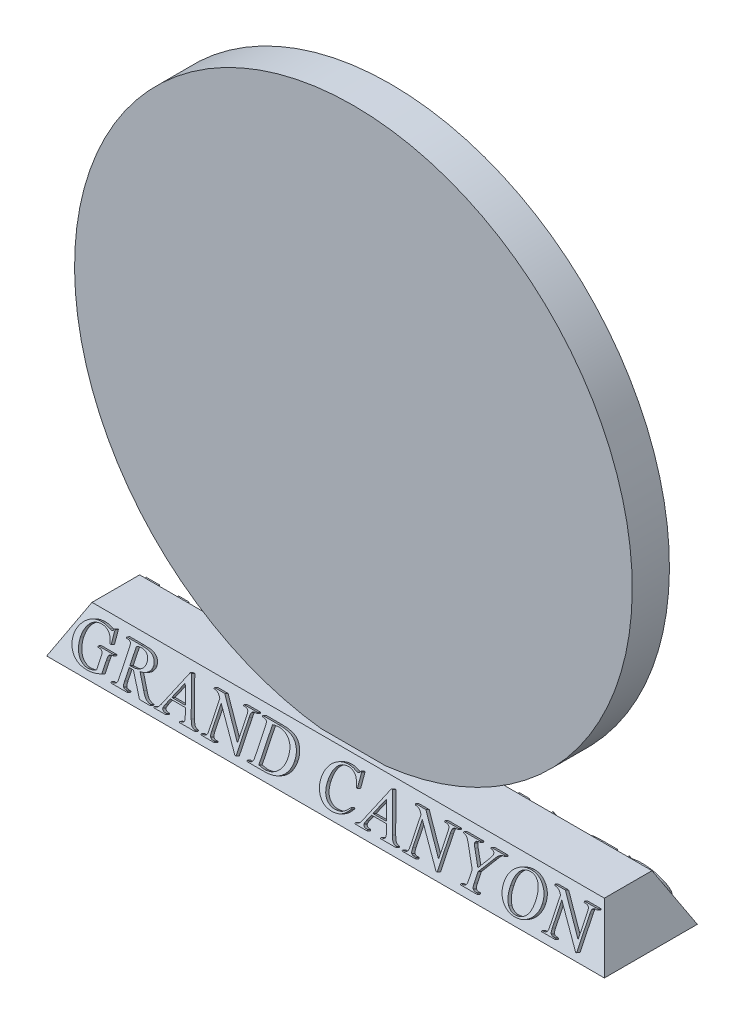
from build123d import *

# Parameters (mm, degrees)
SKETCH1_W                = 76.2
SKETCH1_H                = 12.7
BOSS_EXTRUDE1_DEPTH      = 6.35
BOSS_EXTRUDE1_TAPER      = 26
BOSS_EXTRUDE2_DEPTH      = 2.54
BOSS_EXTRUDE2_DEPTH_BACK = 2.54
SKETCH2_R                = 38.1
BOSS_EXTRUDE3_DEPTH      = 0.508
BOSS_EXTRUDE4_DEPTH      = 0.508


with BuildPart() as part:
    # Sketch1 → Boss-Extrude1 (new body)
    with BuildSketch(Plane(origin=(0, 0, 0), x_dir=(1, 0, 0), z_dir=(0, 1, 0))):
        Rectangle(SKETCH1_W, SKETCH1_H)
    extrude(amount=BOSS_EXTRUDE1_DEPTH, taper=BOSS_EXTRUDE1_TAPER)

    # Sketch2 → Boss-Extrude2 (add, two sides: drawn at the far end of the back side and taken through both)
    with BuildSketch(Plane.XY.offset(-BOSS_EXTRUDE2_DEPTH_BACK)):
        with Locations((0, 44.196)):
            Circle(SKETCH2_R)
    extrude(amount=BOSS_EXTRUDE2_DEPTH + BOSS_EXTRUDE2_DEPTH_BACK)

    # Sketch5 → Boss-Extrude3 (add)
    # profile 1 of 11: a face of its own
    with BuildSketch(Plane(origin=(0, 2.501934143, 5.129725184), x_dir=(1, 0, 0), z_dir=(0, 0.43837114678907857, 0.8987940462991666))):
        with BuildLine():
            Line((-30.933784238, 3.244361441), (-30.797894361, 1.681627849))
            Line((-30.797894361, 1.681627849), (-30.933784238, 1.681627849))
            add(Edge.make_bspline(
                [(-30.933784238, 1.681627849), (-30.951029513, 1.730982752), (-30.984556221, 1.826934098), (-31.041155324, 1.964822019), (-31.101913956, 2.093159444), (-31.164690922, 2.213360185), (-31.233122033, 2.322897817), (-31.304489966, 2.423414713), (-31.379303776, 2.515035626), (-31.433732442, 2.569915468), (-31.460357514, 2.596761243)],
                knots=[0, 0, 0, 0, 1.177174109, 2.288555651, 3.354436225, 4.374000129, 5.340353334, 6.260245638, 7.148957945, 8, 8, 8, 8], degree=3))
            add(Edge.make_bspline(
                [(-31.460357514, 2.596761243), (-31.499586128, 2.632375949), (-31.577811222, 2.703394611), (-31.708334787, 2.792920262), (-31.84578837, 2.869830341), (-31.991283101, 2.933544257), (-32.145884356, 2.980208288), (-32.307932802, 3.01608733), (-32.478690811, 3.035856123), (-32.595203496, 3.038947814), (-32.65470214, 3.040526624)],
                knots=[0, 0, 0, 0, 0.972157334, 1.93856195, 2.898739554, 3.86225493, 4.849011236, 5.859937102, 6.907150414, 8, 8, 8, 8], degree=3))
            add(Edge.make_bspline(
                [(-32.65470214, 3.040526624), (-32.735172249, 3.03842074), (-32.892310755, 3.03430846), (-33.12012379, 2.998347943), (-33.333552041, 2.94165162), (-33.531822801, 2.860084637), (-33.715789829, 2.755931848), (-33.883704377, 2.626742425), (-34.037231422, 2.475390953), (-34.124360665, 2.359438385), (-34.168600307, 2.300563776)],
                knots=[0, 0, 0, 0, 1.098595455, 2.145289119, 3.142033834, 4.108836989, 5.065764818, 6.020994026, 6.995164967, 8, 8, 8, 8], degree=3))
            add(Edge.make_bspline(
                [(-34.168600307, 2.300563776), (-34.203463195, 2.247671164), (-34.2729272, 2.142283089), (-34.361376474, 1.974190364), (-34.435071346, 1.798727669), (-34.497868509, 1.616463163), (-34.54372618, 1.42572094), (-34.577405032, 1.228171444), (-34.599919712, 1.023220755), (-34.601835736, 0.88404341), (-34.602810931, 0.813206601)],
                knots=[0, 0, 0, 0, 0.965564088, 1.923878151, 2.891069393, 3.865459552, 4.860139361, 5.878584746, 6.920267616, 8, 8, 8, 8], degree=3))
            add(Edge.make_bspline(
                [(-34.602810931, 0.813206601), (-34.602089892, 0.755496235), (-34.600663372, 0.641320863), (-34.586402524, 0.471872121), (-34.563088779, 0.306392079), (-34.530944791, 0.144494944), (-34.491377004, -0.014057295), (-34.439771183, -0.167934671), (-34.380015563, -0.318097547), (-34.313124903, -0.464049495), (-34.236285789, -0.602332141), (-34.155229045, -0.732945141), (-34.067951906, -0.853903562), (-33.973766523, -0.963805942), (-33.876793979, -1.067326114), (-33.770965766, -1.157706286), (-33.661316537, -1.240639951), (-33.545763168, -1.312317651), (-33.426550916, -1.374208601), (-33.30704332, -1.43036873), (-33.185493839, -1.475127272), (-33.064434268, -1.514555357), (-32.94167987, -1.542505914), (-32.818450067, -1.564160779), (-32.694264655, -1.577229499), (-32.611204517, -1.578897265), (-32.569770967, -1.579729211)],
                knots=[0, 0, 0, 0, 1.185843975, 2.346098077, 3.491901481, 4.618712352, 5.737065278, 6.847920039, 7.951321559, 9.057667372, 10.144842226, 11.200243903, 12.215670561, 13.206498411, 14.173551573, 15.1273038, 16.062603323, 16.99696923, 17.917648232, 18.822331341, 19.708465178, 20.577937422, 21.437066817, 22.293174031, 23.14857041, 24, 24, 24, 24], degree=3))
            add(Edge.make_bspline(
                [(-32.569770967, -1.579729211), (-32.521257465, -1.578957473), (-32.425123204, -1.577428199), (-32.282345694, -1.563840248), (-32.141882172, -1.544122875), (-32.003910109, -1.515480594), (-31.868208425, -1.477915781), (-31.735258971, -1.432579395), (-31.60458051, -1.379068199), (-31.519958328, -1.338123438), (-31.477343748, -1.317504213)],
                knots=[0, 0, 0, 0, 1.02646133, 2.034033771, 3.03280018, 4.027176633, 5.013766816, 6.010847068, 6.998289645, 8, 8, 8, 8], degree=3))
            Line((-31.477343748, -1.317504213), (-31.477343748, 0.050949319))
            add(Edge.make_bspline(
                [(-31.477343748, 0.050949319), (-31.477539697, 0.081738776), (-31.477913692, 0.14050478), (-31.480913746, 0.224428606), (-31.486574698, 0.299781203), (-31.492224914, 0.367209708), (-31.501480692, 0.426133541), (-31.513756122, 0.476567897), (-31.525214944, 0.519584035), (-31.547013335, 0.564528734), (-31.578751655, 0.61246242), (-31.625097277, 0.662403449), (-31.681179644, 0.703755094), (-31.747987115, 0.739450783), (-31.832599538, 0.767901766), (-31.940712393, 0.784795048), (-32.074086576, 0.796313857), (-32.171621758, 0.797627988), (-32.224738075, 0.798343646)],
                knots=[0, 0, 0, 0, 1.159546256, 2.213156894, 3.161734201, 4.005149352, 4.761051655, 5.404358391, 5.96092017, 6.431920658, 7.278383864, 8.117576635, 8.983847074, 9.890099226, 10.960600819, 12.327861077, 14.000203711, 16, 16, 16, 16], degree=3))
            Line((-32.224738075, 0.798343646), (-32.224738075, 0.934233523))
            Line((-32.224738075, 0.934233523), (-30.118444973, 0.934233523))
            Line((-30.118444973, 0.934233523), (-30.118444973, 0.798343646))
            Line((-30.118444973, 0.798343646), (-30.219300742, 0.798343646))
            add(Edge.make_bspline(
                [(-30.219300742, 0.798343646), (-30.244463993, 0.797810493), (-30.292863068, 0.796785027), (-30.362128614, 0.786837116), (-30.42561891, 0.772275263), (-30.483045512, 0.751512238), (-30.534054719, 0.723233677), (-30.578986818, 0.688839878), (-30.618839458, 0.648968257), (-30.639162, 0.617556047), (-30.649264807, 0.601940307)],
                knots=[0, 0, 0, 0, 1.217649282, 2.342030392, 3.381049042, 4.367745999, 5.288088412, 6.192826581, 7.101612092, 8, 8, 8, 8], degree=3))
            add(Edge.make_bspline(
                [(-30.649264807, 0.601940307), (-30.656018718, 0.589009172), (-30.670558694, 0.561170723), (-30.685325428, 0.512862278), (-30.69943005, 0.456950385), (-30.710940557, 0.392402693), (-30.718944072, 0.318963717), (-30.725193813, 0.237172306), (-30.729711405, 0.146900176), (-30.729867768, 0.083866276), (-30.729949422, 0.050949319)],
                knots=[0, 0, 0, 0, 0.622294544, 1.339690251, 2.150343873, 3.087789732, 4.138338392, 5.306418797, 6.593383951, 8, 8, 8, 8], degree=3))
            Line((-30.729949422, 0.050949319), (-30.729949422, -1.371647836))
            add(Edge.make_bspline(
                [(-30.729949422, -1.371647836), (-30.803527416, -1.405802564), (-30.948656924, -1.473171332), (-31.17026263, -1.557578794), (-31.390228821, -1.6290999), (-31.610899922, -1.687327768), (-31.837129605, -1.731389124), (-32.07294117, -1.761701833), (-32.320707731, -1.779823129), (-32.489763176, -1.782298999), (-32.576140805, -1.783564027)],
                knots=[0, 0, 0, 0, 1.019592756, 2.011103979, 2.979118203, 3.926609018, 4.878570604, 5.874672988, 6.914079887, 8, 8, 8, 8], degree=3))
            add(Edge.make_bspline(
                [(-32.576140805, -1.783564027), (-32.638792412, -1.783046476), (-32.762066546, -1.782028134), (-32.944142126, -1.771175233), (-33.12047252, -1.75301066), (-33.29120862, -1.728754136), (-33.456410966, -1.698166296), (-33.615555366, -1.660049501), (-33.769086333, -1.614471873), (-33.916308738, -1.56064848), (-34.059413792, -1.50342432), (-34.195148894, -1.435514882), (-34.326361072, -1.362573782), (-34.451345248, -1.281817499), (-34.570981059, -1.194462398), (-34.684264113, -1.099968403), (-34.792438659, -0.998927689), (-34.85912586, -0.926207779), (-34.89263856, -0.889663427)],
                knots=[0, 0, 0, 0, 1.173623013, 2.309236219, 3.415520113, 4.493736224, 5.539168594, 6.56186083, 7.558190414, 8.537523221, 9.497821323, 10.443638496, 11.378635825, 12.309156638, 13.229418232, 14.152112428, 15.071370491, 16, 16, 16, 16], degree=3))
            add(Edge.make_bspline(
                [(-34.89263856, -0.889663427), (-34.940013392, -0.833479568), (-35.033539291, -0.722563166), (-35.154598874, -0.544381038), (-35.257332673, -0.360138414), (-35.340352326, -0.169015688), (-35.405413802, 0.028209827), (-35.452314466, 0.231761599), (-35.480462301, 0.441904999), (-35.484203588, 0.584161077), (-35.486095135, 0.65608393)],
                knots=[0, 0, 0, 0, 1.04068688, 2.054491235, 3.046488102, 4.025475446, 5.002161873, 5.984891107, 6.98118673, 8, 8, 8, 8], degree=3))
            add(Edge.make_bspline(
                [(-35.486095135, 0.65608393), (-35.485109504, 0.708856101), (-35.483146972, 0.813933), (-35.466275184, 0.97025116), (-35.441182688, 1.124976165), (-35.404722083, 1.278137591), (-35.358451649, 1.429782567), (-35.300064863, 1.578905021), (-35.233756182, 1.727243973), (-35.181359551, 1.823158947), (-35.154863558, 1.87166135)],
                knots=[0, 0, 0, 0, 0.993744977, 1.978687629, 2.958360812, 3.9446108, 4.941903961, 5.942111012, 6.959364144, 8, 8, 8, 8], degree=3))
            add(Edge.make_bspline(
                [(-35.154863558, 1.87166135), (-35.121262712, 1.928035624), (-35.054626393, 2.039835609), (-34.942505791, 2.198418698), (-34.82156971, 2.347046914), (-34.69175469, 2.485816431), (-34.551991195, 2.613616779), (-34.402980333, 2.731169524), (-34.245977752, 2.8407706), (-34.134461915, 2.903743913), (-34.078360935, 2.935424297)],
                knots=[0, 0, 0, 0, 1.026762898, 2.036249312, 3.036119461, 4.02345717, 5.007325148, 5.996788452, 6.992231655, 8, 8, 8, 8], degree=3))
            add(Edge.make_bspline(
                [(-34.078360935, 2.935424297), (-34.029859143, 2.960198703), (-33.932296264, 3.010033198), (-33.778454746, 3.072423547), (-33.618409661, 3.125215956), (-33.451816775, 3.169110041), (-33.279062445, 3.202607027), (-33.099786966, 3.227484306), (-32.913945433, 3.240812615), (-32.787779926, 3.243166206), (-32.723708719, 3.244361441)],
                knots=[0, 0, 0, 0, 0.930940672, 1.87261644, 2.835137116, 3.811182098, 4.816354797, 5.842438539, 6.904315693, 8, 8, 8, 8], degree=3))
            add(Edge.make_bspline(
                [(-32.723708719, 3.244361441), (-32.677337795, 3.244077184), (-32.586655645, 3.243521297), (-32.45424046, 3.235602006), (-32.328074006, 3.224400571), (-32.203373704, 3.206575464), (-32.069394391, 3.181057186), (-31.916752478, 3.143927565), (-31.739064907, 3.097732415), (-31.613454723, 3.05975406), (-31.546350327, 3.039464985)],
                knots=[0, 0, 0, 0, 0.926921739, 1.812671584, 2.65113098, 3.458570551, 4.329963325, 5.376763734, 6.598595438, 8, 8, 8, 8], degree=3))
            add(Edge.make_bspline(
                [(-31.546350327, 3.039464985), (-31.513549524, 3.029140141), (-31.454291904, 3.010487375), (-31.372916665, 2.99082626), (-31.310075931, 2.976417185), (-31.273551913, 2.973693328), (-31.258645977, 2.972581686)],
                knots=[0, 0, 0, 0, 1.393247915, 2.517028556, 3.394779701, 4, 4, 4, 4], degree=3))
            add(Edge.make_bspline(
                [(-31.258645977, 2.972581686), (-31.235365644, 2.975216421), (-31.18834019, 2.980538493), (-31.137485536, 3.018572082), (-31.106862292, 3.063928168), (-31.088328715, 3.112467013), (-31.076493463, 3.174197332), (-31.072086547, 3.219539995), (-31.069674116, 3.244361441)],
                knots=[0, 0, 0, 0, 1.126233465, 2.27495199, 2.944635462, 3.780450958, 4.784976167, 6, 6, 6, 6], degree=3))
            Line((-31.069674116, 3.244361441), (-30.933784238, 3.244361441))
        make_face()
    # profile 2 of 11: a face of its own
    with BuildSketch(Plane(origin=(0, 2.501934143, 5.129725184), x_dir=(1, 0, 0), z_dir=(0, 0.43837114678907857, 0.8987940462991666))):
        with BuildLine():
            Line((-23.970489656, -1.715619088), (-25.429182559, -1.715619088))
            Line((-25.429182559, -1.715619088), (-27.278558861, 0.594508829))
            add(Edge.make_bspline(
                [(-27.278558861, 0.594508829), (-27.310759244, 0.593342981), (-27.371968227, 0.591126846), (-27.459045363, 0.589581888), (-27.53652032, 0.586567201), (-27.585016525, 0.586914938), (-27.607667158, 0.587077352)],
                knots=[0, 0, 0, 0, 1.174447986, 2.232481717, 3.174463088, 4, 4, 4, 4], degree=3))
            add(Edge.make_bspline(
                [(-27.607667158, 0.587077352), (-27.625714335, 0.587032416), (-27.662873563, 0.586939895), (-27.720244781, 0.587679239), (-27.780351727, 0.591525523), (-27.821408265, 0.593503059), (-27.842289525, 0.594508829)],
                knots=[0, 0, 0, 0, 0.922390876, 1.899207489, 2.931541801, 4, 4, 4, 4], degree=3))
            Line((-27.842289525, 0.594508829), (-27.842289525, -0.832334885))
            add(Edge.make_bspline(
                [(-27.842289525, -0.832334885), (-27.841707808, -0.869847314), (-27.840604372, -0.941003174), (-27.83709435, -1.042349458), (-27.828587517, -1.132352822), (-27.817103431, -1.211027311), (-27.8030868, -1.278922996), (-27.783325977, -1.334910682), (-27.763878525, -1.382312538), (-27.744109213, -1.406315824), (-27.735063918, -1.417298342)],
                knots=[0, 0, 0, 0, 1.490008873, 2.826339535, 4.026224673, 5.077661907, 5.98467426, 6.771332138, 7.437832557, 8, 8, 8, 8], degree=3))
            add(Edge.make_bspline(
                [(-27.735063918, -1.417298342), (-27.708950587, -1.442546417), (-27.65560611, -1.494123341), (-27.550954944, -1.544189522), (-27.429952669, -1.574196846), (-27.343524556, -1.577811424), (-27.297668375, -1.579729211)],
                knots=[0, 0, 0, 0, 0.902522261, 1.843678086, 2.855919866, 4, 4, 4, 4], degree=3))
            Line((-27.297668375, -1.579729211), (-27.094895199, -1.579729211))
            Line((-27.094895199, -1.579729211), (-27.094895199, -1.715619088))
            Line((-27.094895199, -1.715619088), (-29.337078178, -1.715619088))
            Line((-29.337078178, -1.715619088), (-29.337078178, -1.579729211))
            Line((-29.337078178, -1.579729211), (-29.141736479, -1.579729211))
            add(Edge.make_bspline(
                [(-29.141736479, -1.579729211), (-29.115161068, -1.579180274), (-29.063948877, -1.578122444), (-28.990020785, -1.568276314), (-28.921408793, -1.552863961), (-28.859187669, -1.52946937), (-28.802716128, -1.50045131), (-28.752072443, -1.46507513), (-28.707387631, -1.422742411), (-28.682681701, -1.390059843), (-28.670368466, -1.373771115)],
                knots=[0, 0, 0, 0, 1.189080325, 2.291419304, 3.332764949, 4.330291279, 5.258487238, 6.168249877, 7.087070566, 8, 8, 8, 8], degree=3))
            add(Edge.make_bspline(
                [(-28.670368466, -1.373771115), (-28.663618223, -1.362633022), (-28.649013709, -1.338535157), (-28.633727095, -1.294452527), (-28.620145284, -1.241188124), (-28.60868286, -1.178042361), (-28.600632994, -1.105309683), (-28.594371143, -1.02316128), (-28.589919751, -0.931115172), (-28.589764996, -0.866313183), (-28.589683851, -0.832334885)],
                knots=[0, 0, 0, 0, 0.563875307, 1.219974592, 2.013411533, 2.950257012, 4.001811864, 5.187972081, 6.525540243, 8, 8, 8, 8], degree=3))
            Line((-28.589683851, -0.832334885), (-28.589683851, 2.293132298))
            add(Edge.make_bspline(
                [(-28.589683851, 2.293132298), (-28.590265568, 2.330644728), (-28.591369004, 2.401800588), (-28.594879026, 2.503146871), (-28.60338586, 2.593150235), (-28.614869945, 2.671824725), (-28.628886576, 2.73972041), (-28.648647399, 2.795708096), (-28.668094852, 2.843109952), (-28.687864163, 2.867113238), (-28.696909458, 2.878095755)],
                knots=[0, 0, 0, 0, 1.490008873, 2.826339535, 4.026224673, 5.077661907, 5.98467426, 6.771332138, 7.437832557, 8, 8, 8, 8], degree=3))
            add(Edge.make_bspline(
                [(-28.696909458, 2.878095755), (-28.723770565, 2.903309387), (-28.77846405, 2.954648349), (-28.884805099, 3.005448994), (-29.007784411, 3.034707642), (-29.095551314, 3.038520305), (-29.141736479, 3.040526624)],
                knots=[0, 0, 0, 0, 0.903319265, 1.839301597, 2.862985843, 4, 4, 4, 4], degree=3))
            Line((-29.141736479, 3.040526624), (-29.337078178, 3.040526624))
            Line((-29.337078178, 3.040526624), (-29.337078178, 3.176416502))
            Line((-29.337078178, 3.176416502), (-27.369859873, 3.176416502))
            add(Edge.make_bspline(
                [(-27.369859873, 3.176416502), (-27.30049801, 3.175840863), (-27.166716502, 3.174730601), (-26.972733489, 3.170982267), (-26.792860353, 3.162884068), (-26.627299854, 3.149526557), (-26.475953444, 3.135622787), (-26.338954789, 3.116318901), (-26.215628723, 3.094352373), (-26.071101443, 3.061265449), (-25.905906642, 3.005862675), (-25.722570864, 2.917691248), (-25.555197902, 2.805092112), (-25.431210979, 2.692471746), (-25.341176479, 2.594470263), (-25.28435358, 2.515410799), (-25.234587357, 2.434149995), (-25.193868754, 2.3489322), (-25.163358179, 2.259335004), (-25.141114808, 2.166584145), (-25.126572345, 2.070646011), (-25.125190817, 2.005480765), (-25.124491975, 1.972517118)],
                knots=[0, 0, 0, 0, 1.457402833, 2.810961803, 4.076368705, 5.239708638, 6.300646176, 7.269097643, 8.145616892, 8.931972382, 10.382702622, 11.796004415, 13.194184778, 14.605137592, 15.305363631, 15.986499368, 16.647032289, 17.305553429, 17.966295558, 18.631748252, 19.307873922, 20, 20, 20, 20], degree=3))
            add(Edge.make_bspline(
                [(-25.124491975, 1.972517118), (-25.125575093, 1.937080997), (-25.127707691, 1.867309252), (-25.142749544, 1.764377207), (-25.168618831, 1.665304985), (-25.203548625, 1.569002836), (-25.249524022, 1.476691844), (-25.305206861, 1.387688069), (-25.371260851, 1.30292913), (-25.447135711, 1.221762291), (-25.533066819, 1.145143699), (-25.630748417, 1.074768719), (-25.739371751, 1.010381996), (-25.858687294, 0.950536315), (-25.989495919, 0.897843315), (-26.131205413, 0.851552598), (-26.283500553, 0.809742831), (-26.389478249, 0.787510202), (-26.444110082, 0.776049212)],
                knots=[0, 0, 0, 0, 0.87402107, 1.720898719, 2.55932117, 3.396106076, 4.243253617, 5.098235543, 5.981751701, 6.88964148, 7.835674341, 8.816974128, 9.854440288, 10.947522284, 12.106549277, 13.329431254, 14.62331346, 16, 16, 16, 16], degree=3))
            Line((-26.444110082, 0.776049212), (-25.309217277, -0.695383367))
            add(Edge.make_bspline(
                [(-25.309217277, -0.695383367), (-25.279033801, -0.735918872), (-25.220725664, -0.814224957), (-25.132104044, -0.924649117), (-25.048036031, -1.025629342), (-24.965920535, -1.114965694), (-24.887643025, -1.194016245), (-24.811839798, -1.261583701), (-24.7413751, -1.321326242), (-24.647534176, -1.384148014), (-24.522289197, -1.448828057), (-24.356426194, -1.509153054), (-24.170308735, -1.553299539), (-24.038987683, -1.570669113), (-23.970489656, -1.579729211)],
                knots=[0, 0, 0, 0, 1.089973387, 2.10559971, 3.053578388, 3.923353467, 4.722143617, 5.451748606, 6.11338834, 6.712505264, 7.883517779, 9.14406872, 10.510325206, 12, 12, 12, 12], degree=3))
            Line((-23.970489656, -1.579729211), (-23.970489656, -1.715619088))
        make_face()
        with BuildLine():
            add(Edge.make_bspline(
                [(-27.842289525, 0.798343646), (-27.818221094, 0.798594083), (-27.773257764, 0.799061936), (-27.710660624, 0.796059683), (-27.658276328, 0.795002364), (-27.626776918, 0.795111089), (-27.612975357, 0.795158727)],
                knots=[0, 0, 0, 0, 1.259003451, 2.352001531, 3.277924491, 4, 4, 4, 4], degree=3))
            add(Edge.make_bspline(
                [(-27.612975357, 0.795158727), (-27.548546009, 0.796303989), (-27.423782461, 0.798521722), (-27.242547372, 0.811970542), (-27.073535785, 0.835792214), (-26.917286087, 0.871253386), (-26.772599589, 0.914026571), (-26.640521363, 0.968540828), (-26.519865278, 1.031833414), (-26.41234396, 1.105403364), (-26.317402747, 1.186619885), (-26.234394486, 1.273112195), (-26.164807035, 1.365725053), (-26.106133981, 1.462528465), (-26.063372738, 1.566405402), (-26.030706885, 1.674696251), (-26.011387315, 1.788518409), (-26.008989564, 1.866281629), (-26.007776179, 1.905633819)],
                knots=[0, 0, 0, 0, 1.411750848, 2.733770427, 3.97948012, 5.1476786, 6.241672351, 7.281308688, 8.273359498, 9.221816542, 10.129293422, 11.00682651, 11.842707776, 12.663198509, 13.479759473, 14.296725303, 15.138055377, 16, 16, 16, 16], degree=3))
            add(Edge.make_bspline(
                [(-26.007776179, 1.905633819), (-26.008855965, 1.944251853), (-26.010974206, 2.02000975), (-26.025805344, 2.130710386), (-26.051282129, 2.235765629), (-26.087801842, 2.334852502), (-26.133453448, 2.429133164), (-26.190244758, 2.517723719), (-26.257245934, 2.600612633), (-26.334171389, 2.676963918), (-26.418344544, 2.74688151), (-26.510227688, 2.807606245), (-26.608642781, 2.859197392), (-26.714020486, 2.899847391), (-26.82528122, 2.933533479), (-26.943717819, 2.956440121), (-27.068718404, 2.970475671), (-27.154308867, 2.971871309), (-27.197874246, 2.972581686)],
                knots=[0, 0, 0, 0, 1.031207974, 2.022944766, 2.976481027, 3.912289822, 4.837926481, 5.768615122, 6.716184822, 7.678485558, 8.658626928, 9.633697741, 10.614385709, 11.619984863, 12.645591118, 13.715022971, 14.836951133, 16, 16, 16, 16], degree=3))
            add(Edge.make_bspline(
                [(-27.197874246, 2.972581686), (-27.241141751, 2.970664322), (-27.335374567, 2.966488472), (-27.486141459, 2.938609321), (-27.65798679, 2.895779766), (-27.778099399, 2.857271337), (-27.842289525, 2.836691808)],
                knots=[0, 0, 0, 0, 0.785504494, 1.710759632, 2.776592808, 4, 4, 4, 4], degree=3))
            Line((-27.842289525, 2.836691808), (-27.842289525, 0.798343646))
        make_face(mode=Mode.SUBTRACT)
    # profile 3 of 11: a face of its own
    with BuildSketch(Plane(origin=(0, 2.501934143, 5.129725184), x_dir=(1, 0, 0), z_dir=(0, 0.43837114678907857, 0.8987940462991666))):
        with BuildLine():
            Line((-19.886361853, -0.084940558), (-21.928956574, -0.084940558))
            Line((-21.928956574, -0.084940558), (-22.304777016, -0.855690957))
            add(Edge.make_bspline(
                [(-22.304777016, -0.855690957), (-22.324437103, -0.899350035), (-22.360652024, -0.979772368), (-22.402794915, -1.093605592), (-22.429575012, -1.190321514), (-22.434321221, -1.249796255), (-22.436420335, -1.276100266)],
                knots=[0, 0, 0, 0, 1.296016295, 2.387330615, 3.286761549, 4, 4, 4, 4], degree=3))
            add(Edge.make_bspline(
                [(-22.436420335, -1.276100266), (-22.434984677, -1.294386951), (-22.432124511, -1.330818306), (-22.408559191, -1.382682021), (-22.372929458, -1.431223217), (-22.331074743, -1.467185301), (-22.288490782, -1.49362072), (-22.246772307, -1.510979282), (-22.197142622, -1.527220876), (-22.13903273, -1.540163343), (-22.072847236, -1.552942044), (-21.998612455, -1.565058818), (-21.915571964, -1.572728287), (-21.857476097, -1.577322344), (-21.827039166, -1.579729211)],
                knots=[0, 0, 0, 0, 0.878422245, 1.750022658, 2.702247906, 3.76652616, 4.386960912, 5.112932586, 5.938554278, 6.902933499, 7.980534442, 9.189671408, 10.52764431, 12, 12, 12, 12], degree=3))
            Line((-21.827039166, -1.579729211), (-21.827039166, -1.715619088))
            Line((-21.827039166, -1.715619088), (-23.478950489, -1.715619088))
            Line((-23.478950489, -1.715619088), (-23.478950489, -1.579729211))
            add(Edge.make_bspline(
                [(-23.478950489, -1.579729211), (-23.428460691, -1.570745446), (-23.336665538, -1.554412125), (-23.215369656, -1.519818205), (-23.119959038, -1.486402724), (-23.072552904, -1.45218213), (-23.052171343, -1.437469495)],
                knots=[0, 0, 0, 0, 1.353790498, 2.46131715, 3.338466224, 4, 4, 4, 4], degree=3))
            add(Edge.make_bspline(
                [(-23.052171343, -1.437469495), (-23.035301327, -1.421068884), (-22.999353573, -1.386121371), (-22.947286116, -1.32546807), (-22.895932134, -1.252402965), (-22.841559876, -1.169317125), (-22.785123985, -1.075185936), (-22.729803071, -0.968404063), (-22.670703158, -0.851751129), (-22.633214924, -0.769142546), (-22.61371416, -0.726170918)],
                knots=[0, 0, 0, 0, 0.671631881, 1.431157926, 2.27807641, 3.219756435, 4.266446997, 5.410052035, 6.652751579, 8, 8, 8, 8], degree=3))
            Line((-22.61371416, -0.726170918), (-20.677283405, 3.244361441))
            Line((-20.677283405, 3.244361441), (-20.507421059, 3.244361441))
            Line((-20.507421059, 3.244361441), (-18.771640201, -0.787746019))
            add(Edge.make_bspline(
                [(-18.771640201, -0.787746019), (-18.753963067, -0.826501174), (-18.719927432, -0.901120524), (-18.66489242, -1.005817848), (-18.614054221, -1.101583746), (-18.56249076, -1.185328411), (-18.514255329, -1.259651693), (-18.465235224, -1.321846143), (-18.418829759, -1.374805917), (-18.357094643, -1.430808782), (-18.270833307, -1.487361417), (-18.151192964, -1.53349354), (-18.015326668, -1.567569685), (-17.918305818, -1.575529874), (-17.867123204, -1.579729211)],
                knots=[0, 0, 0, 0, 1.189625732, 2.290510699, 3.303515275, 4.21731729, 5.037094027, 5.776654568, 6.427669258, 7.001535963, 8.100999746, 9.285026432, 10.567736295, 12, 12, 12, 12], degree=3))
            Line((-17.867123204, -1.579729211), (-17.867123204, -1.715619088))
            Line((-17.867123204, -1.715619088), (-19.975539585, -1.715619088))
            Line((-19.975539585, -1.715619088), (-19.975539585, -1.579729211))
            add(Edge.make_bspline(
                [(-19.975539585, -1.579729211), (-19.927285726, -1.576880126), (-19.838796176, -1.571655379), (-19.719494786, -1.55010665), (-19.623622951, -1.523997059), (-19.552533545, -1.484453217), (-19.501284665, -1.438493363), (-19.466795559, -1.387096519), (-19.443444644, -1.331799785), (-19.441466939, -1.292608146), (-19.440473192, -1.272915347)],
                knots=[0, 0, 0, 0, 1.692456798, 3.103684181, 4.245461326, 5.156292076, 5.928934597, 6.634221135, 7.313730959, 8, 8, 8, 8], degree=3))
            add(Edge.make_bspline(
                [(-19.440473192, -1.272915347), (-19.442767197, -1.241633464), (-19.447973324, -1.170640817), (-19.480155326, -1.053896869), (-19.529240476, -0.914081574), (-19.572136605, -0.814381405), (-19.595472584, -0.760143387)],
                knots=[0, 0, 0, 0, 0.697477714, 1.582890329, 2.685065039, 4, 4, 4, 4], degree=3))
            Line((-19.595472584, -0.760143387), (-19.886361853, -0.084940558))
        make_face()
        Polygon((-19.973416305, 0.118894258), (-20.843960833, 2.082927644), (-21.830224085, 0.118894258), align=None, mode=Mode.SUBTRACT)
    # profile 4 of 11: a face of its own
    with BuildSketch(Plane(origin=(0, 2.501934143, 5.129725184), x_dir=(1, 0, 0), z_dir=(0, 0.43837114678907857, 0.8987940462991666))):
        with BuildLine():
            Line((-17.328871892, 3.176416502), (-15.932815729, 3.176416502))
            Line((-15.932815729, 3.176416502), (-12.554678305, -0.556308571))
            Line((-12.554678305, -0.556308571), (-12.554678305, 2.293132298))
            add(Edge.make_bspline(
                [(-12.554678305, 2.293132298), (-12.555248197, 2.330646352), (-12.556329202, 2.401805292), (-12.559989105, 2.503130994), (-12.568050335, 2.593603), (-12.581180347, 2.672807532), (-12.595077667, 2.741742385), (-12.614119744, 2.798975714), (-12.635670342, 2.846184143), (-12.655089606, 2.870945887), (-12.664027191, 2.882342314)],
                knots=[0, 0, 0, 0, 1.478837801, 2.805149566, 3.996038782, 5.055506326, 5.969340183, 6.763320786, 7.430826717, 8, 8, 8, 8], degree=3))
            add(Edge.make_bspline(
                [(-12.664027191, 2.882342314), (-12.690164217, 2.906923492), (-12.744492711, 2.958017998), (-12.852712188, 3.00623779), (-12.97940995, 3.036415908), (-13.070774879, 3.039097427), (-13.119470609, 3.040526624)],
                knots=[0, 0, 0, 0, 0.863001778, 1.793837867, 2.824158489, 4, 4, 4, 4], degree=3))
            Line((-13.119470609, 3.040526624), (-13.302072632, 3.040526624))
            Line((-13.302072632, 3.040526624), (-13.302072632, 3.176416502))
            Line((-13.302072632, 3.176416502), (-11.467559285, 3.176416502))
            Line((-11.467559285, 3.176416502), (-11.467559285, 3.040526624))
            Line((-11.467559285, 3.040526624), (-11.654407867, 3.040526624))
            add(Edge.make_bspline(
                [(-11.654407867, 3.040526624), (-11.681341505, 3.040004204), (-11.733267177, 3.038997024), (-11.808109843, 3.028794211), (-11.87703793, 3.014863693), (-11.939744151, 2.993211381), (-11.996462023, 2.965450178), (-12.04777507, 2.931878544), (-12.091887638, 2.890687461), (-12.116589946, 2.859661172), (-12.128960798, 2.844123286)],
                knots=[0, 0, 0, 0, 1.209250981, 2.331328955, 3.388450744, 4.363866067, 5.302434964, 6.21961887, 7.10838967, 8, 8, 8, 8], degree=3))
            add(Edge.make_bspline(
                [(-12.128960798, 2.844123286), (-12.136095273, 2.832648552), (-12.151650553, 2.807630213), (-12.167525368, 2.76192872), (-12.182498418, 2.707358649), (-12.194850957, 2.643109851), (-12.204405573, 2.569022938), (-12.21006233, 2.485708667), (-12.214783458, 2.39262554), (-12.214894893, 2.327466276), (-12.214953612, 2.293132298)],
                knots=[0, 0, 0, 0, 0.573705711, 1.250849434, 2.04765325, 2.984308823, 4.032686016, 5.226347654, 6.538496082, 8, 8, 8, 8], degree=3))
            Line((-12.214953612, 2.293132298), (-12.214953612, -1.794180424))
            Line((-12.214953612, -1.794180424), (-12.354028408, -1.794180424))
            Line((-12.354028408, -1.794180424), (-15.951925243, 2.125393231))
            Line((-15.951925243, 2.125393231), (-15.951925243, -0.832334885))
            add(Edge.make_bspline(
                [(-15.951925243, -0.832334885), (-15.951340218, -0.869846465), (-15.950230507, -0.941000715), (-15.946762415, -1.042357759), (-15.938087398, -1.132675217), (-15.926899327, -1.212142582), (-15.9122276, -1.280735395), (-15.894610573, -1.338103055), (-15.874084442, -1.385266102), (-15.85539848, -1.410132803), (-15.846822916, -1.4215449)],
                knots=[0, 0, 0, 0, 1.482638461, 2.812358889, 4.006308728, 5.066379638, 5.982562076, 6.774272063, 7.4374756, 8, 8, 8, 8], degree=3))
            add(Edge.make_bspline(
                [(-15.846822916, -1.4215449), (-15.819928563, -1.446075142), (-15.764461538, -1.496666412), (-15.656404356, -1.545344168), (-15.530380718, -1.575634649), (-15.439718967, -1.578305274), (-15.391379498, -1.579729211)],
                knots=[0, 0, 0, 0, 0.876974517, 1.808675837, 2.831619233, 4, 4, 4, 4], degree=3))
            Line((-15.391379498, -1.579729211), (-15.204530917, -1.579729211))
            Line((-15.204530917, -1.579729211), (-15.204530917, -1.715619088))
            Line((-15.204530917, -1.715619088), (-17.039044263, -1.715619088))
            Line((-17.039044263, -1.715619088), (-17.039044263, -1.579729211))
            Line((-17.039044263, -1.579729211), (-16.85644224, -1.579729211))
            add(Edge.make_bspline(
                [(-16.85644224, -1.579729211), (-16.829156582, -1.57919789), (-16.776529317, -1.578173105), (-16.700954519, -1.56812363), (-16.631369528, -1.553920134), (-16.56802276, -1.532315235), (-16.510430753, -1.505322082), (-16.459764231, -1.470341792), (-16.414692831, -1.430312263), (-16.389951885, -1.398936144), (-16.37764275, -1.383325872)],
                knots=[0, 0, 0, 0, 1.216086746, 2.345529557, 3.394841742, 4.37798381, 5.323812803, 6.221132727, 7.114976539, 8, 8, 8, 8], degree=3))
            add(Edge.make_bspline(
                [(-16.37764275, -1.383325872), (-16.370508276, -1.371851139), (-16.354952996, -1.3468328), (-16.33907818, -1.301131307), (-16.32410513, -1.246561235), (-16.311752591, -1.182312437), (-16.302197975, -1.108225524), (-16.296541218, -1.024911253), (-16.29182009, -0.931828126), (-16.291708655, -0.866668863), (-16.291649937, -0.832334885)],
                knots=[0, 0, 0, 0, 0.573705711, 1.250849434, 2.04765325, 2.984308823, 4.032686016, 5.226347654, 6.538496082, 8, 8, 8, 8], degree=3))
            Line((-16.291649937, -0.832334885), (-16.291649937, 2.496967114))
            add(Edge.make_bspline(
                [(-16.291649937, 2.496967114), (-16.326968907, 2.538050222), (-16.391992239, 2.613685512), (-16.486893448, 2.711841518), (-16.565585206, 2.789964152), (-16.636858121, 2.847168109), (-16.708403026, 2.891738599), (-16.788808892, 2.931890181), (-16.882841341, 2.970852565), (-16.951119905, 2.993554692), (-16.987023919, 3.005492515)],
                knots=[0, 0, 0, 0, 1.480984832, 2.726539504, 3.732530977, 4.510782746, 5.219521865, 6.033064901, 6.965694936, 8, 8, 8, 8], degree=3))
            add(Edge.make_bspline(
                [(-16.987023919, 3.005492515), (-17.008187857, 3.010772227), (-17.054710765, 3.022378175), (-17.133180552, 3.03375355), (-17.226158813, 3.03940214), (-17.293122461, 3.040135246), (-17.328871892, 3.040526624)],
                knots=[0, 0, 0, 0, 0.759092024, 1.668648305, 2.755376975, 4, 4, 4, 4], degree=3))
            Line((-17.328871892, 3.040526624), (-17.328871892, 3.176416502))
        make_face()
    # profile 5 of 11: a face of its own
    with BuildSketch(Plane(origin=(0, 2.501934143, 5.129725184), x_dir=(1, 0, 0), z_dir=(0, 0.43837114678907857, 0.8987940462991666))):
        with BuildLine():
            Line((-10.754137428, -1.715619088), (-10.754137428, -1.579729211))
            Line((-10.754137428, -1.579729211), (-10.558795729, -1.579729211))
            add(Edge.make_bspline(
                [(-10.558795729, -1.579729211), (-10.532222902, -1.579173799), (-10.481015688, -1.578103492), (-10.407052982, -1.56834413), (-10.339005154, -1.552730685), (-10.276774671, -1.530612076), (-10.22120679, -1.501296577), (-10.170310231, -1.467596732), (-10.126269136, -1.425776805), (-10.102527574, -1.393269931), (-10.090612636, -1.376956034)],
                knots=[0, 0, 0, 0, 1.198300048, 2.309186186, 3.358606069, 4.343375335, 5.278768209, 6.186505145, 7.089879628, 8, 8, 8, 8], degree=3))
            add(Edge.make_bspline(
                [(-10.090612636, -1.376956034), (-10.083493712, -1.365477008), (-10.067972337, -1.340449308), (-10.051820456, -1.294918602), (-10.038534396, -1.240765741), (-10.026853126, -1.177298878), (-10.017386203, -1.104679965), (-10.011537295, -1.022087485), (-10.006963748, -0.930410671), (-10.006818751, -0.865960414), (-10.006743102, -0.832334885)],
                knots=[0, 0, 0, 0, 0.58070754, 1.266115507, 2.068741736, 2.984003496, 4.045175677, 5.222995034, 6.551157663, 8, 8, 8, 8], degree=3))
            Line((-10.006743102, -0.832334885), (-10.006743102, 2.293132298))
            add(Edge.make_bspline(
                [(-10.006743102, 2.293132298), (-10.007321914, 2.330290858), (-10.008419277, 2.400739243), (-10.011973872, 2.50137777), (-10.020461956, 2.591019924), (-10.031872716, 2.66972307), (-10.046185701, 2.737861168), (-10.065425488, 2.794409882), (-10.085463211, 2.842175849), (-10.104954309, 2.866736669), (-10.113968709, 2.878095755)],
                knots=[0, 0, 0, 0, 1.476597225, 2.799459655, 3.999865095, 5.05175826, 5.959163917, 6.759489104, 7.426278535, 8, 8, 8, 8], degree=3))
            add(Edge.make_bspline(
                [(-10.113968709, 2.878095755), (-10.140829816, 2.903309387), (-10.1955233, 2.954648349), (-10.30186435, 3.005448994), (-10.424843662, 3.034707642), (-10.512610565, 3.038520305), (-10.558795729, 3.040526624)],
                knots=[0, 0, 0, 0, 0.903319265, 1.839301597, 2.862985843, 4, 4, 4, 4], degree=3))
            Line((-10.558795729, 3.040526624), (-10.754137428, 3.040526624))
            Line((-10.754137428, 3.040526624), (-10.754137428, 3.176416502))
            Line((-10.754137428, 3.176416502), (-8.557604955, 3.176416502))
            add(Edge.make_bspline(
                [(-8.557604955, 3.176416502), (-8.459920611, 3.175586996), (-8.27049571, 3.173978457), (-7.995061067, 3.162017473), (-7.73753163, 3.143794828), (-7.498139807, 3.116094376), (-7.277051567, 3.081383987), (-7.073728204, 3.039600804), (-6.888621066, 2.988797321), (-6.719771137, 2.929907669), (-6.563283955, 2.862453031), (-6.416948137, 2.783745002), (-6.278400353, 2.694665758), (-6.145775869, 2.598037617), (-6.024085799, 2.48692284), (-5.907534019, 2.368580332), (-5.80025736, 2.238093477), (-5.701163707, 2.098562942), (-5.610375975, 1.951700337), (-5.533522049, 1.796872513), (-5.4658964, 1.637752953), (-5.41155004, 1.472281585), (-5.370489111, 1.301026008), (-5.340870519, 1.124375671), (-5.322284701, 0.942060536), (-5.319802256, 0.818559287), (-5.318542328, 0.755878059)],
                knots=[0, 0, 0, 0, 1.52413474, 2.955530659, 4.300967056, 5.55160497, 6.714472317, 7.791986133, 8.788639677, 9.707193573, 10.580137922, 11.444765151, 12.296406558, 13.14896037, 14.001406892, 14.864357545, 15.73888959, 16.633669112, 17.533308001, 18.429687564, 19.328020747, 20.229014208, 21.143709735, 22.073250838, 23.022107036, 24, 24, 24, 24], degree=3))
            add(Edge.make_bspline(
                [(-5.318542328, 0.755878059), (-5.320516139, 0.672263026), (-5.324386712, 0.508296891), (-5.356816135, 0.267463748), (-5.411316644, 0.037680048), (-5.485268659, -0.182644405), (-5.582635487, -0.391704536), (-5.701669307, -0.590057369), (-5.840099714, -0.779439763), (-5.948558393, -0.893612828), (-6.003299914, -0.951238527)],
                knots=[0, 0, 0, 0, 1.061615889, 2.081791361, 3.079261392, 4.05708756, 5.028291348, 6.001780226, 6.99145379, 8, 8, 8, 8], degree=3))
            add(Edge.make_bspline(
                [(-6.003299914, -0.951238527), (-6.035787856, -0.982498145), (-6.101266657, -1.045501284), (-6.207568214, -1.131662916), (-6.319226245, -1.213005374), (-6.437712265, -1.287143903), (-6.561843141, -1.35639344), (-6.692695115, -1.419103826), (-6.829864145, -1.474809851), (-6.972620607, -1.526586344), (-7.122481334, -1.570469787), (-7.278200688, -1.60990806), (-7.440431359, -1.643016025), (-7.608817892, -1.66887474), (-7.783649848, -1.69060051), (-7.96465014, -1.705111577), (-8.151976532, -1.713588488), (-8.278738765, -1.714934901), (-8.343153742, -1.715619088)],
                knots=[0, 0, 0, 0, 0.85636249, 1.725981585, 2.597600315, 3.480046381, 4.380072831, 5.297416726, 6.235235215, 7.192382361, 8.181704626, 9.201035317, 10.244197708, 11.326526393, 12.437512154, 13.591246342, 14.775977592, 16, 16, 16, 16], degree=3))
            Line((-8.343153742, -1.715619088), (-10.754137428, -1.715619088))
        make_face()
        with BuildLine():
            add(Edge.make_bspline(
                [(-9.259348776, -1.407743585), (-9.176675915, -1.423787195), (-9.018914213, -1.454402652), (-8.791309441, -1.485252839), (-8.584951016, -1.507876728), (-8.453970578, -1.510529127), (-8.391989167, -1.511784272)],
                knots=[0, 0, 0, 0, 1.154883638, 2.203823696, 3.150029234, 4, 4, 4, 4], degree=3))
            add(Edge.make_bspline(
                [(-8.391989167, -1.511784272), (-8.31474371, -1.510062347), (-8.163241074, -1.506685111), (-7.941281327, -1.476775237), (-7.729179779, -1.430915712), (-7.527200126, -1.364523058), (-7.335269876, -1.279550666), (-7.153646557, -1.174606353), (-6.982416504, -1.050957796), (-6.822059977, -0.90981827), (-6.676035479, -0.752906759), (-6.548719151, -0.580451328), (-6.440990516, -0.395051002), (-6.353635741, -0.195831823), (-6.285581834, 0.016606986), (-6.237304358, 0.242769582), (-6.206701803, 0.48219828), (-6.203475811, 0.646433772), (-6.201826532, 0.730398707)],
                knots=[0, 0, 0, 0, 1.051136645, 2.06160957, 3.043471576, 4.001742867, 4.95070472, 5.896039891, 6.852031774, 7.821440178, 8.799844913, 9.764356799, 10.733609568, 11.712903466, 12.719971249, 13.765073669, 14.857400169, 16, 16, 16, 16], degree=3))
            add(Edge.make_bspline(
                [(-6.201826532, 0.730398707), (-6.203471524, 0.815069955), (-6.206682814, 0.980361911), (-6.237171922, 1.220879754), (-6.285747814, 1.447680733), (-6.353644516, 1.660846101), (-6.440764301, 1.860896291), (-6.548453684, 2.046401455), (-6.67607946, 2.21797153), (-6.82246887, 2.374148816), (-6.983251288, 2.514927448), (-7.15617382, 2.638253508), (-7.34102023, 2.741061467), (-7.535751802, 2.827114111), (-7.742703805, 2.89103638), (-7.959770901, 2.939659968), (-8.188874383, 2.966942163), (-8.34520868, 2.970677566), (-8.424899997, 2.972581686)],
                knots=[0, 0, 0, 0, 1.141375344, 2.228149085, 3.263407672, 4.265534014, 5.239972555, 6.200095919, 7.151689556, 8.117382876, 9.081246749, 10.029339752, 10.975858059, 11.928982167, 12.894934869, 13.891877636, 14.925385847, 16, 16, 16, 16], degree=3))
            add(Edge.make_bspline(
                [(-8.424899997, 2.972581686), (-8.48793824, 2.971323262), (-8.618913912, 2.968708614), (-8.821320711, 2.947257962), (-9.036670082, 2.913083378), (-9.183399389, 2.881634507), (-9.259348776, 2.865356079)],
                knots=[0, 0, 0, 0, 0.897213391, 1.864156131, 2.894453776, 4, 4, 4, 4], degree=3))
            Line((-9.259348776, 2.865356079), (-9.259348776, -1.407743585))
        make_face(mode=Mode.SUBTRACT)
    # profile 6 of 11: a face of its own
    with BuildSketch(Plane(origin=(0, 2.501934143, 5.129725184), x_dir=(1, 0, 0), z_dir=(0, 0.43837114678907857, 0.8987940462991666))):
        with BuildLine():
            Line((2.766905384, 3.244361441), (2.902795261, 1.545737972))
            Line((2.902795261, 1.545737972), (2.766905384, 1.545737972))
            add(Edge.make_bspline(
                [(2.766905384, 1.545737972), (2.74726765, 1.610096702), (2.70911445, 1.735136154), (2.63871365, 1.912695839), (2.565575183, 2.077573068), (2.48452581, 2.227963262), (2.397550533, 2.364493763), (2.303980886, 2.487209282), (2.204009569, 2.596261588), (2.097268734, 2.691077995), (1.984741946, 2.773583737), (1.866840747, 2.844412625), (1.743871095, 2.905712904), (1.615288079, 2.955598295), (1.48096272, 2.994116722), (1.341153469, 3.019745022), (1.1965099, 3.037983277), (1.098067028, 3.039670446), (1.048110761, 3.040526624)],
                knots=[0, 0, 0, 0, 1.305525187, 2.536441504, 3.70464368, 4.804875659, 5.849024731, 6.843674502, 7.796435259, 8.715957942, 9.61032834, 10.500892439, 11.38251127, 12.274134305, 13.174236388, 14.090289113, 15.030889438, 16, 16, 16, 16], degree=3))
            add(Edge.make_bspline(
                [(1.048110761, 3.040526624), (1.005985176, 3.039512232), (0.922314456, 3.037497425), (0.798404402, 3.027463362), (0.677636053, 3.007620343), (0.559885144, 2.981988081), (0.44589743, 2.945707774), (0.333918198, 2.905184793), (0.225719333, 2.854647437), (0.120286464, 2.797620874), (0.019418445, 2.732078916), (-0.075854333, 2.656788672), (-0.165872844, 2.573200982), (-0.250714367, 2.48002115), (-0.328218407, 2.376857822), (-0.40257311, 2.266282486), (-0.468759298, 2.145161309), (-0.53197183, 2.016466908), (-0.586305132, 1.877980538), (-0.635993067, 1.732407752), (-0.675678261, 1.578206062), (-0.708428242, 1.415843423), (-0.735408828, 1.245559042), (-0.752389089, 1.066489274), (-0.765113618, 0.879919142), (-0.765854237, 0.752716753), (-0.766231432, 0.68793312)],
                knots=[0, 0, 0, 0, 0.902478543, 1.792521773, 2.659811694, 3.522219179, 4.370928258, 5.219908058, 6.071151763, 6.925897712, 7.785736665, 8.643970566, 9.523527629, 10.414248349, 11.338987266, 12.28497744, 13.265587845, 14.292752772, 15.354001206, 16.449374013, 17.585526406, 18.761337757, 19.996273215, 21.276144138, 22.612751849, 24, 24, 24, 24], degree=3))
            add(Edge.make_bspline(
                [(-0.766231432, 0.68793312), (-0.765704146, 0.634127231), (-0.76466584, 0.528175274), (-0.753970136, 0.372236525), (-0.735536604, 0.221759966), (-0.71175532, 0.076655851), (-0.679809616, -0.063033823), (-0.640275082, -0.196857618), (-0.594870652, -0.325787013), (-0.541918139, -0.44899295), (-0.481449283, -0.565633302), (-0.414253409, -0.675750078), (-0.340126041, -0.77903668), (-0.257703045, -0.874544633), (-0.169708062, -0.964344473), (-0.07376274, -1.046358539), (0.029738375, -1.120415437), (0.139046067, -1.188679632), (0.254447012, -1.248876754), (0.374427782, -1.300868754), (0.498337715, -1.344486785), (0.626002642, -1.380545817), (0.757804055, -1.409473421), (0.893671099, -1.429407121), (1.033391484, -1.441207784), (1.127711047, -1.44295429), (1.175507521, -1.443839333)],
                knots=[0, 0, 0, 0, 1.185563574, 2.334554494, 3.442069544, 4.52537976, 5.573394965, 6.597461765, 7.598860447, 8.583911413, 9.550044, 10.491598927, 11.424426402, 12.348081954, 13.268968116, 14.192623668, 15.125451144, 16.071098476, 17.030313896, 17.990796443, 18.950233731, 19.922859238, 20.912498808, 21.921610559, 22.946775364, 24, 24, 24, 24], degree=3))
            add(Edge.make_bspline(
                [(1.175507521, -1.443839333), (1.257394043, -1.441801116), (1.41740446, -1.437818335), (1.649623679, -1.400837801), (1.867153045, -1.341604901), (2.038284076, -1.271385009), (2.168883518, -1.198093016), (2.27022449, -1.13387143), (2.3719763, -1.055047408), (2.477116524, -0.965715259), (2.585283011, -0.865212552), (2.6948472, -0.751626992), (2.806930958, -0.626831307), (2.880788265, -0.538153358), (2.918719856, -0.492610191)],
                knots=[0, 0, 0, 0, 1.423781164, 2.782140612, 4.078608466, 5.339760698, 5.987373063, 6.6824396, 7.424939306, 8.224275662, 9.082428508, 9.992374147, 10.968924725, 12, 12, 12, 12], degree=3))
            Line((2.918719856, -0.492610191), (3.038685139, -0.56055513))
            add(Edge.make_bspline(
                [(3.038685139, -0.56055513), (3.005927488, -0.61185306), (2.941392231, -0.712914191), (2.837569451, -0.856049708), (2.729078523, -0.988312662), (2.615941354, -1.109128936), (2.500906894, -1.221899824), (2.378886672, -1.320949681), (2.255181638, -1.412285362), (2.125454273, -1.490972345), (1.991429479, -1.560296824), (1.851193939, -1.620043089), (1.705077872, -1.670814497), (1.552582192, -1.712465966), (1.394252197, -1.743767403), (1.229886461, -1.767477126), (1.05932482, -1.781390833), (0.943387523, -1.78283299), (0.884618252, -1.783564027)],
                knots=[0, 0, 0, 0, 1.121082726, 2.208624913, 3.255364788, 4.270191622, 5.256861661, 6.220122875, 7.162914821, 8.087568113, 9.011853622, 9.940634441, 10.893158402, 11.859459206, 12.850320131, 13.86447667, 14.917491171, 16, 16, 16, 16], degree=3))
            add(Edge.make_bspline(
                [(0.884618252, -1.783564027), (0.831515552, -1.783071473), (0.726615485, -1.782098472), (0.571496332, -1.770781903), (0.420836755, -1.754371011), (0.274759558, -1.730022068), (0.133749729, -1.69738412), (-0.003734048, -1.661507223), (-0.135468855, -1.614890454), (-0.263115622, -1.563022699), (-0.386691588, -1.504613747), (-0.505691211, -1.4389854), (-0.619386065, -1.365193286), (-0.728874311, -1.285437207), (-0.834435795, -1.199651265), (-0.934333086, -1.105553877), (-1.030027414, -1.004855302), (-1.089712203, -0.933177439), (-1.119757441, -0.897094904)],
                knots=[0, 0, 0, 0, 1.121523283, 2.215478069, 3.283691569, 4.322143372, 5.341340538, 6.340520827, 7.321612995, 8.290554946, 9.250225067, 10.207183714, 11.158931118, 12.111382825, 13.06758205, 14.030130185, 15.008370335, 16, 16, 16, 16], degree=3))
            add(Edge.make_bspline(
                [(-1.119757441, -0.897094904), (-1.162192485, -0.841549457), (-1.246213436, -0.731570043), (-1.353643298, -0.554551082), (-1.445185809, -0.37104756), (-1.519897395, -0.179460285), (-1.578337711, 0.01905278), (-1.619714873, 0.225072442), (-1.644523125, 0.438191712), (-1.647835688, 0.582764624), (-1.649515635, 0.65608393)],
                knots=[0, 0, 0, 0, 1.001717703, 1.983390718, 2.963738237, 3.939029806, 4.928124007, 5.927267919, 6.948826063, 8, 8, 8, 8], degree=3))
            add(Edge.make_bspline(
                [(-1.649515635, 0.65608393), (-1.64849851, 0.715569429), (-1.646484775, 0.833340681), (-1.630302445, 1.00824177), (-1.602725136, 1.179153197), (-1.563979618, 1.346311907), (-1.516620006, 1.510489527), (-1.457193726, 1.670968154), (-1.385411741, 1.82680768), (-1.305179997, 1.97910672), (-1.21403111, 2.124433423), (-1.115395067, 2.263233874), (-1.007788756, 2.392671988), (-0.892941336, 2.514396949), (-0.769383847, 2.627138486), (-0.637424035, 2.731468635), (-0.497039824, 2.826816026), (-0.349680138, 2.914016735), (-0.196057519, 2.99077724), (-0.038944849, 3.05916156), (0.122028242, 3.11678693), (0.286330089, 3.163160119), (0.454317892, 3.199912068), (0.625733662, 3.224476773), (0.800762796, 3.241497172), (0.918549327, 3.243400222), (0.978042543, 3.244361441)],
                knots=[0, 0, 0, 0, 1.040081575, 2.05918606, 3.068397558, 4.065162377, 5.058000788, 6.054611921, 7.054311426, 8.056440384, 9.062668826, 10.051797556, 11.031903259, 12.003670825, 12.976068692, 13.954120996, 14.942765671, 15.941449561, 16.946040217, 17.943860982, 18.936236441, 19.93330856, 20.927380454, 21.94081394, 22.959918425, 24, 24, 24, 24], degree=3))
            add(Edge.make_bspline(
                [(0.978042543, 3.244361441), (1.071264213, 3.242034207), (1.257826504, 3.23737677), (1.53587119, 3.195659524), (1.812593417, 3.13248621), (1.991749187, 3.068544063), (2.082147798, 3.036280066)],
                knots=[0, 0, 0, 0, 0.989771841, 1.980806633, 2.981153253, 4, 4, 4, 4], degree=3))
            add(Edge.make_bspline(
                [(2.082147798, 3.036280066), (2.106833304, 3.02682668), (2.152324545, 3.009405679), (2.215286032, 2.98924365), (2.267073911, 2.976168153), (2.297965159, 2.973672201), (2.311461966, 2.972581686)],
                knots=[0, 0, 0, 0, 1.327139677, 2.445695524, 3.320903208, 4, 4, 4, 4], degree=3))
            add(Edge.make_bspline(
                [(2.311461966, 2.972581686), (2.328164957, 2.973060925), (2.360870983, 2.97399932), (2.407664224, 2.985204678), (2.451530831, 3.001879371), (2.477007723, 3.019118942), (2.48981743, 3.027786948)],
                knots=[0, 0, 0, 0, 1.053210643, 2.062285431, 3.025722726, 4, 4, 4, 4], degree=3))
            add(Edge.make_bspline(
                [(2.48981743, 3.027786948), (2.506053461, 3.041314841), (2.538671797, 3.068492501), (2.575935252, 3.121246678), (2.609344628, 3.178997097), (2.623629751, 3.222084308), (2.631015506, 3.244361441)],
                knots=[0, 0, 0, 0, 0.961556597, 1.931776042, 2.930678097, 4, 4, 4, 4], degree=3))
            Line((2.631015506, 3.244361441), (2.766905384, 3.244361441))
        make_face()
    # profile 7 of 11: a face of its own
    with BuildSketch(Plane(origin=(0, 2.501934143, 5.129725184), x_dir=(1, 0, 0), z_dir=(0, 0.43837114678907857, 0.8987940462991666))):
        with BuildLine():
            Line((7.597365873, -0.084940558), (5.554771152, -0.084940558))
            Line((5.554771152, -0.084940558), (5.178950709, -0.855690957))
            add(Edge.make_bspline(
                [(5.178950709, -0.855690957), (5.159290623, -0.899350035), (5.123075702, -0.979772368), (5.080932811, -1.093605592), (5.054152713, -1.190321514), (5.049406505, -1.249796255), (5.047307391, -1.276100266)],
                knots=[0, 0, 0, 0, 1.296016295, 2.387330615, 3.286761549, 4, 4, 4, 4], degree=3))
            add(Edge.make_bspline(
                [(5.047307391, -1.276100266), (5.048743049, -1.294386951), (5.051603215, -1.330818306), (5.075168535, -1.382682021), (5.110798268, -1.431223217), (5.152652983, -1.467185301), (5.195236944, -1.49362072), (5.236955419, -1.510979282), (5.286585103, -1.527220876), (5.344694996, -1.540163343), (5.41088049, -1.552942044), (5.485115271, -1.565058818), (5.568155762, -1.572728287), (5.626251628, -1.577322344), (5.65668856, -1.579729211)],
                knots=[0, 0, 0, 0, 0.878422245, 1.750022658, 2.702247906, 3.76652616, 4.386960912, 5.112932586, 5.938554278, 6.902933499, 7.980534442, 9.189671408, 10.52764431, 12, 12, 12, 12], degree=3))
            Line((5.65668856, -1.579729211), (5.65668856, -1.715619088))
            Line((5.65668856, -1.715619088), (4.004777237, -1.715619088))
            Line((4.004777237, -1.715619088), (4.004777237, -1.579729211))
            add(Edge.make_bspline(
                [(4.004777237, -1.579729211), (4.055267035, -1.570745446), (4.147062188, -1.554412125), (4.26835807, -1.519818205), (4.363768688, -1.486402724), (4.411174822, -1.45218213), (4.431556383, -1.437469495)],
                knots=[0, 0, 0, 0, 1.353790498, 2.46131715, 3.338466224, 4, 4, 4, 4], degree=3))
            add(Edge.make_bspline(
                [(4.431556383, -1.437469495), (4.448426399, -1.421068884), (4.484374153, -1.386121371), (4.53644161, -1.32546807), (4.587795592, -1.252402965), (4.64216785, -1.169317125), (4.698603741, -1.075185936), (4.753924655, -0.968404063), (4.813024568, -0.851751129), (4.850512802, -0.769142546), (4.870013566, -0.726170918)],
                knots=[0, 0, 0, 0, 0.671631881, 1.431157926, 2.27807641, 3.219756435, 4.266446997, 5.410052035, 6.652751579, 8, 8, 8, 8], degree=3))
            Line((4.870013566, -0.726170918), (6.806444321, 3.244361441))
            Line((6.806444321, 3.244361441), (6.976306667, 3.244361441))
            Line((6.976306667, 3.244361441), (8.712087525, -0.787746019))
            add(Edge.make_bspline(
                [(8.712087525, -0.787746019), (8.729764659, -0.826501174), (8.763800294, -0.901120524), (8.818835306, -1.005817848), (8.869673505, -1.101583746), (8.921236966, -1.185328411), (8.969472396, -1.259651693), (9.018492502, -1.321846143), (9.064897967, -1.374805917), (9.126633083, -1.430808782), (9.212894419, -1.487361417), (9.332534762, -1.53349354), (9.468401058, -1.567569685), (9.565421908, -1.575529874), (9.616604522, -1.579729211)],
                knots=[0, 0, 0, 0, 1.189625732, 2.290510699, 3.303515275, 4.21731729, 5.037094027, 5.776654568, 6.427669258, 7.001535963, 8.100999746, 9.285026432, 10.567736295, 12, 12, 12, 12], degree=3))
            Line((9.616604522, -1.579729211), (9.616604522, -1.715619088))
            Line((9.616604522, -1.715619088), (7.508188141, -1.715619088))
            Line((7.508188141, -1.715619088), (7.508188141, -1.579729211))
            add(Edge.make_bspline(
                [(7.508188141, -1.579729211), (7.556442, -1.576880126), (7.644931549, -1.571655379), (7.76423294, -1.55010665), (7.860104775, -1.523997059), (7.931194181, -1.484453217), (7.982443061, -1.438493363), (8.016932167, -1.387096519), (8.040283082, -1.331799785), (8.042260787, -1.292608146), (8.043254534, -1.272915347)],
                knots=[0, 0, 0, 0, 1.692456798, 3.103684181, 4.245461326, 5.156292076, 5.928934597, 6.634221135, 7.313730959, 8, 8, 8, 8], degree=3))
            add(Edge.make_bspline(
                [(8.043254534, -1.272915347), (8.040960529, -1.241633464), (8.035754402, -1.170640817), (8.0035724, -1.053896869), (7.95448725, -0.914081574), (7.911591121, -0.814381405), (7.888255142, -0.760143387)],
                knots=[0, 0, 0, 0, 0.697477714, 1.582890329, 2.685065039, 4, 4, 4, 4], degree=3))
            Line((7.888255142, -0.760143387), (7.597365873, -0.084940558))
        make_face()
        Polygon((7.51031142, 0.118894258), (6.639766893, 2.082927644), (5.653503641, 0.118894258), align=None, mode=Mode.SUBTRACT)
    # profile 8 of 11: a face of its own
    with BuildSketch(Plane(origin=(0, 2.501934143, 5.129725184), x_dir=(1, 0, 0), z_dir=(0, 0.43837114678907857, 0.8987940462991666))):
        with BuildLine():
            Line((10.154855833, 3.176416502), (11.550911997, 3.176416502))
            Line((11.550911997, 3.176416502), (14.929049421, -0.556308571))
            Line((14.929049421, -0.556308571), (14.929049421, 2.293132298))
            add(Edge.make_bspline(
                [(14.929049421, 2.293132298), (14.928479529, 2.330646352), (14.927398524, 2.401805292), (14.92373862, 2.503130994), (14.915677391, 2.593603), (14.902547379, 2.672807532), (14.888650059, 2.741742385), (14.869607982, 2.798975714), (14.848057384, 2.846184143), (14.82863812, 2.870945887), (14.819700535, 2.882342314)],
                knots=[0, 0, 0, 0, 1.478837801, 2.805149566, 3.996038782, 5.055506326, 5.969340183, 6.763320786, 7.430826717, 8, 8, 8, 8], degree=3))
            add(Edge.make_bspline(
                [(14.819700535, 2.882342314), (14.793563509, 2.906923492), (14.739235015, 2.958017998), (14.631015537, 3.00623779), (14.504317776, 3.036415908), (14.412952847, 3.039097427), (14.364257117, 3.040526624)],
                knots=[0, 0, 0, 0, 0.863001778, 1.793837867, 2.824158489, 4, 4, 4, 4], degree=3))
            Line((14.364257117, 3.040526624), (14.181655094, 3.040526624))
            Line((14.181655094, 3.040526624), (14.181655094, 3.176416502))
            Line((14.181655094, 3.176416502), (16.016168441, 3.176416502))
            Line((16.016168441, 3.176416502), (16.016168441, 3.040526624))
            Line((16.016168441, 3.040526624), (15.829319859, 3.040526624))
            add(Edge.make_bspline(
                [(15.829319859, 3.040526624), (15.802386221, 3.040004204), (15.750460549, 3.038997024), (15.675617883, 3.028794211), (15.606689796, 3.014863693), (15.543983575, 2.993211381), (15.487265703, 2.965450178), (15.435952656, 2.931878544), (15.391840088, 2.890687461), (15.36713778, 2.859661172), (15.354766928, 2.844123286)],
                knots=[0, 0, 0, 0, 1.209250981, 2.331328955, 3.388450744, 4.363866067, 5.302434964, 6.21961887, 7.10838967, 8, 8, 8, 8], degree=3))
            add(Edge.make_bspline(
                [(15.354766928, 2.844123286), (15.347632453, 2.832648552), (15.332077173, 2.807630213), (15.316202358, 2.76192872), (15.301229308, 2.707358649), (15.288876769, 2.643109851), (15.279322153, 2.569022938), (15.273665396, 2.485708667), (15.268944268, 2.39262554), (15.268832832, 2.327466276), (15.268774114, 2.293132298)],
                knots=[0, 0, 0, 0, 0.573705711, 1.250849434, 2.04765325, 2.984308823, 4.032686016, 5.226347654, 6.538496082, 8, 8, 8, 8], degree=3))
            Line((15.268774114, 2.293132298), (15.268774114, -1.794180424))
            Line((15.268774114, -1.794180424), (15.129699318, -1.794180424))
            Line((15.129699318, -1.794180424), (11.531802483, 2.125393231))
            Line((11.531802483, 2.125393231), (11.531802483, -0.832334885))
            add(Edge.make_bspline(
                [(11.531802483, -0.832334885), (11.532387508, -0.869846465), (11.533497219, -0.941000715), (11.536965311, -1.042357759), (11.545640328, -1.132675217), (11.556828399, -1.212142582), (11.571500126, -1.280735395), (11.589117152, -1.338103055), (11.609643284, -1.385266102), (11.628329245, -1.410132803), (11.63690481, -1.4215449)],
                knots=[0, 0, 0, 0, 1.482638461, 2.812358889, 4.006308728, 5.066379638, 5.982562076, 6.774272063, 7.4374756, 8, 8, 8, 8], degree=3))
            add(Edge.make_bspline(
                [(11.63690481, -1.4215449), (11.663799163, -1.446075142), (11.719266188, -1.496666412), (11.82732337, -1.545344168), (11.953347008, -1.575634649), (12.044008759, -1.578305274), (12.092348228, -1.579729211)],
                knots=[0, 0, 0, 0, 0.876974517, 1.808675837, 2.831619233, 4, 4, 4, 4], degree=3))
            Line((12.092348228, -1.579729211), (12.279196809, -1.579729211))
            Line((12.279196809, -1.579729211), (12.279196809, -1.715619088))
            Line((12.279196809, -1.715619088), (10.444683463, -1.715619088))
            Line((10.444683463, -1.715619088), (10.444683463, -1.579729211))
            Line((10.444683463, -1.579729211), (10.627285486, -1.579729211))
            add(Edge.make_bspline(
                [(10.627285486, -1.579729211), (10.654571144, -1.57919789), (10.707198409, -1.578173105), (10.782773207, -1.56812363), (10.852358198, -1.553920134), (10.915704966, -1.532315235), (10.973296973, -1.505322082), (11.023963495, -1.470341792), (11.069034895, -1.430312263), (11.093775841, -1.398936144), (11.106084976, -1.383325872)],
                knots=[0, 0, 0, 0, 1.216086746, 2.345529557, 3.394841742, 4.37798381, 5.323812803, 6.221132727, 7.114976539, 8, 8, 8, 8], degree=3))
            add(Edge.make_bspline(
                [(11.106084976, -1.383325872), (11.11321945, -1.371851139), (11.12877473, -1.3468328), (11.144649546, -1.301131307), (11.159622596, -1.246561235), (11.171975135, -1.182312437), (11.181529751, -1.108225524), (11.187186508, -1.024911253), (11.191907636, -0.931828126), (11.192019071, -0.866668863), (11.192077789, -0.832334885)],
                knots=[0, 0, 0, 0, 0.573705711, 1.250849434, 2.04765325, 2.984308823, 4.032686016, 5.226347654, 6.538496082, 8, 8, 8, 8], degree=3))
            Line((11.192077789, -0.832334885), (11.192077789, 2.496967114))
            add(Edge.make_bspline(
                [(11.192077789, 2.496967114), (11.156758819, 2.538050222), (11.091735487, 2.613685512), (10.996834278, 2.711841518), (10.91814252, 2.789964152), (10.846869605, 2.847168109), (10.7753247, 2.891738599), (10.694918834, 2.931890181), (10.600886385, 2.970852565), (10.53260782, 2.993554692), (10.496703807, 3.005492515)],
                knots=[0, 0, 0, 0, 1.480984832, 2.726539504, 3.732530977, 4.510782746, 5.219521865, 6.033064901, 6.965694936, 8, 8, 8, 8], degree=3))
            add(Edge.make_bspline(
                [(10.496703807, 3.005492515), (10.475539869, 3.010772227), (10.429016961, 3.022378175), (10.350547174, 3.03375355), (10.257568913, 3.03940214), (10.190605265, 3.040135246), (10.154855833, 3.040526624)],
                knots=[0, 0, 0, 0, 0.759092024, 1.668648305, 2.755376975, 4, 4, 4, 4], degree=3))
            Line((10.154855833, 3.040526624), (10.154855833, 3.176416502))
        make_face()
    # profile 9 of 11: a face of its own
    with BuildSketch(Plane(origin=(0, 2.501934143, 5.129725184), x_dir=(1, 0, 0), z_dir=(0, 0.43837114678907857, 0.8987940462991666))):
        with BuildLine():
            Line((20.492041281, 3.176416502), (22.345664141, 3.176416502))
            Line((22.345664141, 3.176416502), (22.345664141, 3.040526624))
            Line((22.345664141, 3.040526624), (22.244808373, 3.040526624))
            add(Edge.make_bspline(
                [(22.244808373, 3.040526624), (22.225971276, 3.039295638), (22.183874367, 3.036544644), (22.1159418, 3.018566278), (22.035858108, 2.993370026), (21.947127236, 2.956720614), (21.854127781, 2.911037458), (21.762514628, 2.856191237), (21.676155546, 2.790592595), (21.591549514, 2.713881415), (21.506233468, 2.619012304), (21.412145024, 2.503575392), (21.310371458, 2.36257144), (21.241205891, 2.259043742), (21.204401498, 2.203954566)],
                knots=[0, 0, 0, 0, 0.489996879, 1.095038881, 1.819849015, 2.674467365, 3.588298119, 4.513324413, 5.446647892, 6.404475979, 7.479338231, 8.761620931, 10.27679319, 12, 12, 12, 12], degree=3))
            Line((21.204401498, 2.203954566), (19.923002419, 0.342900228))
            Line((19.923002419, 0.342900228), (19.923002419, -0.832334885))
            add(Edge.make_bspline(
                [(19.923002419, -0.832334885), (19.923572311, -0.869848938), (19.924653315, -0.941007878), (19.928313219, -1.04233358), (19.936374449, -1.132805587), (19.949504461, -1.212010118), (19.963401781, -1.280944971), (19.982443858, -1.3381783), (20.003994456, -1.385386729), (20.02341372, -1.410148474), (20.032351305, -1.4215449)],
                knots=[0, 0, 0, 0, 1.478837801, 2.805149566, 3.996038782, 5.055506326, 5.969340183, 6.763320786, 7.430826717, 8, 8, 8, 8], degree=3))
            add(Edge.make_bspline(
                [(20.032351305, -1.4215449), (20.05959773, -1.44610006), (20.11605103, -1.496977185), (20.226684656, -1.545668364), (20.356294331, -1.575542849), (20.449729595, -1.578274782), (20.499472759, -1.579729211)],
                knots=[0, 0, 0, 0, 0.864229912, 1.790643404, 2.823780419, 4, 4, 4, 4], degree=3))
            Line((20.499472759, -1.579729211), (20.670396745, -1.579729211))
            Line((20.670396745, -1.579729211), (20.670396745, -1.715619088))
            Line((20.670396745, -1.715619088), (18.428213766, -1.715619088))
            Line((18.428213766, -1.715619088), (18.428213766, -1.579729211))
            Line((18.428213766, -1.579729211), (18.615062348, -1.579729211))
            add(Edge.make_bspline(
                [(18.615062348, -1.579729211), (18.641995986, -1.579206791), (18.693921658, -1.57819961), (18.768764324, -1.567996797), (18.837692412, -1.554066279), (18.900398632, -1.532413968), (18.957116504, -1.504652764), (19.008429551, -1.47108113), (19.052542119, -1.429890048), (19.077244427, -1.398863759), (19.08961528, -1.383325872)],
                knots=[0, 0, 0, 0, 1.209250981, 2.331328955, 3.388450744, 4.363866067, 5.302434964, 6.21961887, 7.10838967, 8, 8, 8, 8], degree=3))
            add(Edge.make_bspline(
                [(19.08961528, -1.383325872), (19.096749754, -1.371851139), (19.112305034, -1.3468328), (19.128179849, -1.301131307), (19.143152899, -1.246561235), (19.155505438, -1.182312437), (19.165060054, -1.108225524), (19.170716811, -1.024911253), (19.175437939, -0.931828126), (19.175549375, -0.866668863), (19.175608093, -0.832334885)],
                knots=[0, 0, 0, 0, 0.573705711, 1.250849434, 2.04765325, 2.984308823, 4.032686016, 5.226347654, 6.538496082, 8, 8, 8, 8], degree=3))
            Line((19.175608093, -0.832334885), (19.175608093, 0.232489702))
            Line((19.175608093, 0.232489702), (17.706298792, 2.340906083))
            add(Edge.make_bspline(
                [(17.706298792, 2.340906083), (17.685875406, 2.3696438), (17.647123923, 2.424170958), (17.590240525, 2.500874062), (17.539459019, 2.569645824), (17.494545351, 2.630680917), (17.452175423, 2.681020142), (17.417815788, 2.725341431), (17.386978111, 2.760076957), (17.350735489, 2.798744222), (17.29606424, 2.842259287), (17.212344125, 2.89266861), (17.10523352, 2.948615223), (17.024250831, 2.98474821), (16.980137259, 3.004430876)],
                knots=[0, 0, 0, 0, 1.262893379, 2.396223248, 3.420517564, 4.325627524, 5.109629484, 5.776806863, 6.333710537, 6.773022401, 7.673861272, 8.824080137, 10.269986193, 12, 12, 12, 12], degree=3))
            add(Edge.make_bspline(
                [(16.980137259, 3.004430876), (16.965748546, 3.010107486), (16.935129913, 3.022187096), (16.882632312, 3.033702455), (16.821732765, 3.039354814), (16.778083554, 3.040122084), (16.75506965, 3.040526624)],
                knots=[0, 0, 0, 0, 0.807571024, 1.718480355, 2.797076187, 4, 4, 4, 4], degree=3))
            Line((16.75506965, 3.040526624), (16.75506965, 3.176416502))
            Line((16.75506965, 3.176416502), (19.022731981, 3.176416502))
            Line((19.022731981, 3.176416502), (19.022731981, 3.040526624))
            Line((19.022731981, 3.040526624), (18.905951617, 3.040526624))
            add(Edge.make_bspline(
                [(18.905951617, 3.040526624), (18.875806692, 3.03947723), (18.816559813, 3.037414747), (18.729644336, 3.021951816), (18.646124577, 2.99753102), (18.568212163, 2.963992382), (18.500293871, 2.920453098), (18.44898764, 2.865276314), (18.418148069, 2.797724536), (18.41498684, 2.749246711), (18.413350811, 2.724158003)],
                knots=[0, 0, 0, 0, 1.114168543, 2.189788494, 3.253885328, 4.326077317, 5.316847345, 6.215547523, 7.076493067, 8, 8, 8, 8], degree=3))
            add(Edge.make_bspline(
                [(18.413350811, 2.724158003), (18.414447639, 2.712075692), (18.416834396, 2.685783917), (18.428332854, 2.643249357), (18.447948058, 2.594883214), (18.474675129, 2.539625361), (18.509241399, 2.47794511), (18.550144218, 2.409277342), (18.599762401, 2.334703795), (18.635496531, 2.283159703), (18.654343016, 2.25597491)],
                knots=[0, 0, 0, 0, 0.546796881, 1.18986019, 1.978824097, 2.900374558, 3.95839859, 5.169122263, 6.506971, 8, 8, 8, 8], degree=3))
            Line((18.654343016, 2.25597491), (19.753140072, 0.679440003))
            Line((19.753140072, 0.679440003), (20.791423667, 2.188029971))
            add(Edge.make_bspline(
                [(20.791423667, 2.188029971), (20.809573898, 2.215208488), (20.844409856, 2.267372546), (20.892667433, 2.343170899), (20.931802784, 2.414900589), (20.964784116, 2.480203394), (20.991325662, 2.54017752), (21.008585789, 2.59516216), (21.022324263, 2.644579732), (21.023410952, 2.676305252), (21.023922755, 2.691247174)],
                knots=[0, 0, 0, 0, 1.398945126, 2.685012368, 3.844325746, 4.894286002, 5.817133943, 6.645799947, 7.36220585, 8, 8, 8, 8], degree=3))
            add(Edge.make_bspline(
                [(21.023922755, 2.691247174), (21.021561053, 2.72367034), (21.016899581, 2.787666421), (20.970159527, 2.874528065), (20.900711067, 2.948006155), (20.82105771, 2.990899256), (20.744625729, 3.0179077), (20.671861845, 3.030288409), (20.586385359, 3.03887795), (20.524982005, 3.039950981), (20.492041281, 3.040526624)],
                knots=[0, 0, 0, 0, 1.078984249, 2.129673612, 3.229081272, 4.430027034, 5.120476798, 5.941947963, 6.895927991, 8, 8, 8, 8], degree=3))
            Line((20.492041281, 3.040526624), (20.492041281, 3.176416502))
        make_face()
    # profile 10 of 11: a face of its own
    with BuildSketch(Plane(origin=(0, 2.501934143, 5.129725184), x_dir=(1, 0, 0), z_dir=(0, 0.43837114678907857, 0.8987940462991666))):
        with BuildLine():
            add(Edge.make_bspline(
                [(25.953115733, 3.244361441), (26.038522968, 3.242568977), (26.207205786, 3.239028786), (26.45519212, 3.203478879), (26.694815157, 3.148449339), (26.926086362, 3.071249083), (27.1476033, 2.96902778), (27.36108039, 2.846977075), (27.564677226, 2.700873518), (27.757993235, 2.53621711), (27.935836159, 2.354976422), (28.091862447, 2.159816615), (28.223879751, 1.953420701), (28.332425719, 1.736218927), (28.415389679, 1.507355224), (28.474429155, 1.267504482), (28.511912855, 1.016804632), (28.515973858, 0.845897441), (28.518037171, 0.759062978)],
                knots=[0, 0, 0, 0, 1.030560655, 2.035399866, 3.017891114, 3.99608105, 4.973066588, 5.958757613, 6.960540217, 7.993966395, 9.021218262, 10.021432559, 11.005149299, 11.973888265, 12.947045354, 13.937687125, 14.952180824, 16, 16, 16, 16], degree=3))
            add(Edge.make_bspline(
                [(28.518037171, 0.759062978), (28.515978717, 0.669403583), (28.511941894, 0.493573074), (28.474669555, 0.235684489), (28.414473965, -0.010131719), (28.330084743, -0.244813601), (28.221160449, -0.467420482), (28.088797131, -0.679044182), (27.931608357, -0.878488379), (27.751857759, -1.063527144), (27.556288184, -1.232280056), (27.348166255, -1.379583781), (27.130428929, -1.504723246), (26.902303377, -1.607368142), (26.663350211, -1.68578085), (26.41455697, -1.742030421), (26.155811233, -1.776856032), (25.979765774, -1.781306724), (25.890478993, -1.783564027)],
                knots=[0, 0, 0, 0, 1.054541163, 2.068054445, 3.058839607, 4.028323443, 4.996760354, 5.969618864, 6.960123955, 7.979089048, 9.00077338, 9.99556713, 10.974865687, 11.951566691, 12.933932649, 13.928979123, 14.949619104, 16, 16, 16, 16], degree=3))
            add(Edge.make_bspline(
                [(25.890478993, -1.783564027), (25.800109518, -1.781852413), (25.622595373, -1.778490264), (25.362497937, -1.742266098), (25.11272842, -1.689904713), (24.875002328, -1.610965359), (24.647070099, -1.512606845), (24.431741856, -1.389381297), (24.22579026, -1.246557646), (24.034571216, -1.081430277), (23.858065964, -0.900700402), (23.70598714, -0.702496387), (23.575031197, -0.492990155), (23.470094148, -0.269094761), (23.386260852, -0.033613163), (23.328553364, 0.215719613), (23.292620191, 0.477737078), (23.288419059, 0.657026373), (23.286276887, 0.748446581)],
                knots=[0, 0, 0, 0, 1.065802857, 2.093572877, 3.09379447, 4.073765478, 5.044436941, 6.018838873, 6.99668952, 7.997808794, 8.996136514, 9.972684157, 10.940431186, 11.906274843, 12.88506151, 13.884908104, 14.921507598, 16, 16, 16, 16], degree=3))
            add(Edge.make_bspline(
                [(23.286276887, 0.748446581), (23.288921199, 0.841663006), (23.294114814, 1.02474667), (23.335260719, 1.292919799), (23.403168886, 1.547855968), (23.498173496, 1.789973501), (23.621047976, 2.018244416), (23.771232174, 2.23311699), (23.947995654, 2.43535499), (24.08360002, 2.555712724), (24.152574856, 2.616932397)],
                knots=[0, 0, 0, 0, 1.049432394, 2.061159591, 3.047222974, 4.015241736, 4.983457373, 5.959678169, 6.962195181, 8, 8, 8, 8], degree=3))
            add(Edge.make_bspline(
                [(24.152574856, 2.616932397), (24.216092722, 2.667343504), (24.341939499, 2.767222101), (24.545288643, 2.894759818), (24.757533107, 3.002536794), (24.979019153, 3.090591572), (25.209376342, 3.160376789), (25.449369793, 3.20842384), (25.698218656, 3.239368816), (25.867383225, 3.242682213), (25.953115733, 3.244361441)],
                knots=[0, 0, 0, 0, 0.999001034, 1.979302342, 2.952805322, 3.929732858, 4.913725186, 5.915541439, 6.943597578, 8, 8, 8, 8], degree=3))
        make_face()
        with BuildLine():
            add(Edge.make_bspline(
                [(25.877739317, 3.040526624), (25.818910714, 3.039262449), (25.703598626, 3.036784492), (25.535103196, 3.012528992), (25.375348826, 2.974689096), (25.224349963, 2.921800181), (25.083193706, 2.851546429), (24.949804624, 2.767830906), (24.825658055, 2.667692269), (24.752269788, 2.590204785), (24.715243881, 2.551110737)],
                knots=[0, 0, 0, 0, 1.084269375, 2.125315912, 3.132004849, 4.108304332, 5.068505513, 6.033507011, 7.00786339, 8, 8, 8, 8], degree=3))
            add(Edge.make_bspline(
                [(24.715243881, 2.551110737), (24.671535652, 2.498244893), (24.583113918, 2.391297306), (24.471689828, 2.211150623), (24.378092574, 2.013300101), (24.302186849, 1.797460613), (24.24142873, 1.564621937), (24.19993658, 1.313746928), (24.174055419, 1.045898991), (24.171087628, 0.861396609), (24.169561091, 0.766494455)],
                knots=[0, 0, 0, 0, 0.862135958, 1.744100777, 2.656114293, 3.610797372, 4.618226148, 5.679449227, 6.806382536, 8, 8, 8, 8], degree=3))
            add(Edge.make_bspline(
                [(24.169561091, 0.766494455), (24.17102219, 0.669114911), (24.17386519, 0.479634241), (24.200746191, 0.203904739), (24.244924204, -0.054482473), (24.306114883, -0.295891025), (24.385591732, -0.520105302), (24.483622117, -0.726565713), (24.597719082, -0.917212399), (24.689779024, -1.030104049), (24.735415034, -1.086066765)],
                knots=[0, 0, 0, 0, 1.180678996, 2.297359752, 3.355671624, 4.356995362, 5.313975335, 6.235412906, 7.125257833, 8, 8, 8, 8], degree=3))
            add(Edge.make_bspline(
                [(24.735415034, -1.086066765), (24.77200712, -1.125597661), (24.844345748, -1.203746001), (24.968034858, -1.303328653), (25.099140562, -1.38900097), (25.238930149, -1.459551887), (25.387507066, -1.514015921), (25.544652491, -1.551672355), (25.710298421, -1.576060141), (25.823860158, -1.578487027), (25.881985876, -1.579729211)],
                knots=[0, 0, 0, 0, 1.001851468, 1.980552846, 2.947381541, 3.913940749, 4.889553997, 5.886801025, 6.91837505, 8, 8, 8, 8], degree=3))
            add(Edge.make_bspline(
                [(25.881985876, -1.579729211), (25.94400107, -1.578142168), (26.066092538, -1.575017702), (26.245085799, -1.549017203), (26.415657112, -1.506312596), (26.578589163, -1.448322403), (26.731716905, -1.370754665), (26.877765807, -1.278330085), (27.013352529, -1.1663054), (27.14283705, -1.040756923), (27.25962757, -0.895146682), (27.360153098, -0.729179556), (27.446968135, -0.544457926), (27.514798702, -0.339162905), (27.568746818, -0.115416266), (27.607643873, 0.127678106), (27.631064852, 0.390210323), (27.633496557, 0.57181001), (27.634752968, 0.665638687)],
                knots=[0, 0, 0, 0, 0.922467288, 1.816093398, 2.684541875, 3.535721071, 4.383489237, 5.23362536, 6.102073837, 6.995730976, 7.913497149, 8.870791151, 9.876671994, 10.944060181, 12.082008912, 13.29830421, 14.604091528, 16, 16, 16, 16], degree=3))
            add(Edge.make_bspline(
                [(27.634752968, 0.665638687), (27.63324544, 0.767613124), (27.630330004, 0.964823447), (27.604492133, 1.250713943), (27.562693223, 1.516566659), (27.504050819, 1.763086331), (27.426277498, 1.988988016), (27.332828857, 2.195749553), (27.222439945, 2.383103231), (27.132925663, 2.493015275), (27.089070178, 2.546864179)],
                knots=[0, 0, 0, 0, 1.223081896, 2.365341573, 3.440133951, 4.449173658, 5.401011493, 6.301478985, 7.167848307, 8, 8, 8, 8], degree=3))
            add(Edge.make_bspline(
                [(27.089070178, 2.546864179), (27.051787765, 2.586432056), (26.977849712, 2.664902615), (26.850703823, 2.764733421), (26.714123091, 2.850355251), (26.567037186, 2.920530398), (26.409359145, 2.975316438), (26.241146188, 3.012483095), (26.062824882, 3.036889265), (25.940460811, 3.039294002), (25.877739317, 3.040526624)],
                knots=[0, 0, 0, 0, 0.965473951, 1.914716818, 2.864460033, 3.826956496, 4.805969833, 5.82559037, 6.885438999, 8, 8, 8, 8], degree=3))
        make_face(mode=Mode.SUBTRACT)
    # profile 11 of 11: a face of its own
    with BuildSketch(Plane(origin=(0, 2.501934143, 5.129725184), x_dir=(1, 0, 0), z_dir=(0, 0.43837114678907857, 0.8987940462991666))):
        with BuildLine():
            Line((29.213411154, 3.176416502), (30.609467317, 3.176416502))
            Line((30.609467317, 3.176416502), (33.987604741, -0.556308571))
            Line((33.987604741, -0.556308571), (33.987604741, 2.293132298))
            add(Edge.make_bspline(
                [(33.987604741, 2.293132298), (33.98703485, 2.330646352), (33.985953845, 2.401805292), (33.982293941, 2.503130994), (33.974232712, 2.593603), (33.961102699, 2.672807532), (33.947205379, 2.741742385), (33.928163302, 2.798975714), (33.906612704, 2.846184143), (33.887193441, 2.870945887), (33.878255855, 2.882342314)],
                knots=[0, 0, 0, 0, 1.478837801, 2.805149566, 3.996038782, 5.055506326, 5.969340183, 6.763320786, 7.430826717, 8, 8, 8, 8], degree=3))
            add(Edge.make_bspline(
                [(33.878255855, 2.882342314), (33.852118829, 2.906923492), (33.797790335, 2.958017998), (33.689570858, 3.00623779), (33.562873096, 3.036415908), (33.471508168, 3.039097427), (33.422812438, 3.040526624)],
                knots=[0, 0, 0, 0, 0.863001778, 1.793837867, 2.824158489, 4, 4, 4, 4], degree=3))
            Line((33.422812438, 3.040526624), (33.240210415, 3.040526624))
            Line((33.240210415, 3.040526624), (33.240210415, 3.176416502))
            Line((33.240210415, 3.176416502), (35.074723761, 3.176416502))
            Line((35.074723761, 3.176416502), (35.074723761, 3.040526624))
            Line((35.074723761, 3.040526624), (34.88787518, 3.040526624))
            add(Edge.make_bspline(
                [(34.88787518, 3.040526624), (34.860941542, 3.040004204), (34.80901587, 3.038997024), (34.734173204, 3.028794211), (34.665245116, 3.014863693), (34.602538896, 2.993211381), (34.545821023, 2.965450178), (34.494507976, 2.931878544), (34.450395409, 2.890687461), (34.425693101, 2.859661172), (34.413322248, 2.844123286)],
                knots=[0, 0, 0, 0, 1.209250981, 2.331328955, 3.388450744, 4.363866067, 5.302434964, 6.21961887, 7.10838967, 8, 8, 8, 8], degree=3))
            add(Edge.make_bspline(
                [(34.413322248, 2.844123286), (34.406187774, 2.832648552), (34.390632494, 2.807630213), (34.374757678, 2.76192872), (34.359784628, 2.707358649), (34.347432089, 2.643109851), (34.337877473, 2.569022938), (34.332220716, 2.485708667), (34.327499588, 2.39262554), (34.327388153, 2.327466276), (34.327329435, 2.293132298)],
                knots=[0, 0, 0, 0, 0.573705711, 1.250849434, 2.04765325, 2.984308823, 4.032686016, 5.226347654, 6.538496082, 8, 8, 8, 8], degree=3))
            Line((34.327329435, 2.293132298), (34.327329435, -1.794180424))
            Line((34.327329435, -1.794180424), (34.188254638, -1.794180424))
            Line((34.188254638, -1.794180424), (30.590357803, 2.125393231))
            Line((30.590357803, 2.125393231), (30.590357803, -0.832334885))
            add(Edge.make_bspline(
                [(30.590357803, -0.832334885), (30.590942828, -0.869846465), (30.592052539, -0.941000715), (30.595520631, -1.042357759), (30.604195648, -1.132675217), (30.615383719, -1.212142582), (30.630055447, -1.280735395), (30.647672473, -1.338103055), (30.668198605, -1.385266102), (30.686884566, -1.410132803), (30.695460131, -1.4215449)],
                knots=[0, 0, 0, 0, 1.482638461, 2.812358889, 4.006308728, 5.066379638, 5.982562076, 6.774272063, 7.4374756, 8, 8, 8, 8], degree=3))
            add(Edge.make_bspline(
                [(30.695460131, -1.4215449), (30.722354484, -1.446075142), (30.777821508, -1.496666412), (30.88587869, -1.545344168), (31.011902329, -1.575634649), (31.102564079, -1.578305274), (31.150903548, -1.579729211)],
                knots=[0, 0, 0, 0, 0.876974517, 1.808675837, 2.831619233, 4, 4, 4, 4], degree=3))
            Line((31.150903548, -1.579729211), (31.33775213, -1.579729211))
            Line((31.33775213, -1.579729211), (31.33775213, -1.715619088))
            Line((31.33775213, -1.715619088), (29.503238783, -1.715619088))
            Line((29.503238783, -1.715619088), (29.503238783, -1.579729211))
            Line((29.503238783, -1.579729211), (29.685840806, -1.579729211))
            add(Edge.make_bspline(
                [(29.685840806, -1.579729211), (29.713126465, -1.57919789), (29.765753729, -1.578173105), (29.841328527, -1.56812363), (29.910913518, -1.553920134), (29.974260286, -1.532315235), (30.031852293, -1.505322082), (30.082518816, -1.470341792), (30.127590215, -1.430312263), (30.152331161, -1.398936144), (30.164640297, -1.383325872)],
                knots=[0, 0, 0, 0, 1.216086746, 2.345529557, 3.394841742, 4.37798381, 5.323812803, 6.221132727, 7.114976539, 8, 8, 8, 8], degree=3))
            add(Edge.make_bspline(
                [(30.164640297, -1.383325872), (30.171774771, -1.371851139), (30.187330051, -1.3468328), (30.203204866, -1.301131307), (30.218177916, -1.246561235), (30.230530455, -1.182312437), (30.240085071, -1.108225524), (30.245741828, -1.024911253), (30.250462956, -0.931828126), (30.250574392, -0.866668863), (30.25063311, -0.832334885)],
                knots=[0, 0, 0, 0, 0.573705711, 1.250849434, 2.04765325, 2.984308823, 4.032686016, 5.226347654, 6.538496082, 8, 8, 8, 8], degree=3))
            Line((30.25063311, -0.832334885), (30.25063311, 2.496967114))
            add(Edge.make_bspline(
                [(30.25063311, 2.496967114), (30.215314139, 2.538050222), (30.150290807, 2.613685512), (30.055389599, 2.711841518), (29.97669784, 2.789964152), (29.905424925, 2.847168109), (29.83388002, 2.891738599), (29.753474154, 2.931890181), (29.659441706, 2.970852565), (29.591163141, 2.993554692), (29.555259127, 3.005492515)],
                knots=[0, 0, 0, 0, 1.480984832, 2.726539504, 3.732530977, 4.510782746, 5.219521865, 6.033064901, 6.965694936, 8, 8, 8, 8], degree=3))
            add(Edge.make_bspline(
                [(29.555259127, 3.005492515), (29.53409519, 3.010772227), (29.487572282, 3.022378175), (29.409102495, 3.03375355), (29.316124233, 3.03940214), (29.249160586, 3.040135246), (29.213411154, 3.040526624)],
                knots=[0, 0, 0, 0, 0.759092024, 1.668648305, 2.755376975, 4, 4, 4, 4], degree=3))
            Line((29.213411154, 3.040526624), (29.213411154, 3.176416502))
        make_face()
    extrude(amount=BOSS_EXTRUDE3_DEPTH)

    # Sketch6 → Boss-Extrude4 (add)
    # profile 1 of 11: a face of its own
    with BuildSketch(Plane(origin=(0, 2.501934143, -5.129725184), x_dir=(-1, 0, 0), z_dir=(0, 0.43837114678907857, -0.8987940462991666))):
        with BuildLine():
            Line((-30.933784238, 3.244361441), (-30.797894361, 1.681627849))
            Line((-30.797894361, 1.681627849), (-30.933784238, 1.681627849))
            add(Edge.make_bspline(
                [(-30.933784238, 1.681627849), (-30.951029513, 1.730982752), (-30.984556221, 1.826934098), (-31.041155324, 1.964822019), (-31.101913956, 2.093159444), (-31.164690922, 2.213360185), (-31.233122033, 2.322897817), (-31.304489966, 2.423414713), (-31.379303776, 2.515035626), (-31.433732442, 2.569915468), (-31.460357514, 2.596761243)],
                knots=[0, 0, 0, 0, 1.177174109, 2.288555651, 3.354436225, 4.374000129, 5.340353334, 6.260245638, 7.148957945, 8, 8, 8, 8], degree=3))
            add(Edge.make_bspline(
                [(-31.460357514, 2.596761243), (-31.499586128, 2.632375949), (-31.577811222, 2.703394611), (-31.708334787, 2.792920262), (-31.84578837, 2.869830341), (-31.991283101, 2.933544257), (-32.145884356, 2.980208288), (-32.307932802, 3.01608733), (-32.478690811, 3.035856123), (-32.595203496, 3.038947814), (-32.65470214, 3.040526624)],
                knots=[0, 0, 0, 0, 0.972157334, 1.93856195, 2.898739554, 3.86225493, 4.849011236, 5.859937102, 6.907150414, 8, 8, 8, 8], degree=3))
            add(Edge.make_bspline(
                [(-32.65470214, 3.040526624), (-32.735172249, 3.03842074), (-32.892310755, 3.03430846), (-33.12012379, 2.998347943), (-33.333552041, 2.94165162), (-33.531822801, 2.860084637), (-33.715789829, 2.755931848), (-33.883704377, 2.626742425), (-34.037231422, 2.475390953), (-34.124360665, 2.359438385), (-34.168600307, 2.300563776)],
                knots=[0, 0, 0, 0, 1.098595455, 2.145289119, 3.142033834, 4.108836989, 5.065764818, 6.020994026, 6.995164967, 8, 8, 8, 8], degree=3))
            add(Edge.make_bspline(
                [(-34.168600307, 2.300563776), (-34.203463195, 2.247671164), (-34.2729272, 2.142283089), (-34.361376474, 1.974190364), (-34.435071346, 1.798727669), (-34.497868509, 1.616463163), (-34.54372618, 1.42572094), (-34.577405032, 1.228171444), (-34.599919712, 1.023220755), (-34.601835736, 0.88404341), (-34.602810931, 0.813206601)],
                knots=[0, 0, 0, 0, 0.965564088, 1.923878151, 2.891069393, 3.865459552, 4.860139361, 5.878584746, 6.920267616, 8, 8, 8, 8], degree=3))
            add(Edge.make_bspline(
                [(-34.602810931, 0.813206601), (-34.602089892, 0.755496235), (-34.600663372, 0.641320863), (-34.586402524, 0.471872121), (-34.563088779, 0.306392079), (-34.530944791, 0.144494944), (-34.491377004, -0.014057295), (-34.439771183, -0.167934671), (-34.380015563, -0.318097547), (-34.313124903, -0.464049495), (-34.236285789, -0.602332141), (-34.155229045, -0.732945141), (-34.067951906, -0.853903562), (-33.973766523, -0.963805942), (-33.876793979, -1.067326114), (-33.770965766, -1.157706286), (-33.661316537, -1.240639951), (-33.545763168, -1.312317651), (-33.426550916, -1.374208601), (-33.30704332, -1.43036873), (-33.185493839, -1.475127272), (-33.064434268, -1.514555357), (-32.94167987, -1.542505914), (-32.818450067, -1.564160779), (-32.694264655, -1.577229499), (-32.611204517, -1.578897265), (-32.569770967, -1.579729211)],
                knots=[0, 0, 0, 0, 1.185843975, 2.346098077, 3.491901481, 4.618712352, 5.737065278, 6.847920039, 7.951321559, 9.057667372, 10.144842226, 11.200243903, 12.215670561, 13.206498411, 14.173551573, 15.1273038, 16.062603323, 16.99696923, 17.917648232, 18.822331341, 19.708465178, 20.577937422, 21.437066817, 22.293174031, 23.14857041, 24, 24, 24, 24], degree=3))
            add(Edge.make_bspline(
                [(-32.569770967, -1.579729211), (-32.521257465, -1.578957473), (-32.425123204, -1.577428199), (-32.282345694, -1.563840248), (-32.141882172, -1.544122875), (-32.003910109, -1.515480594), (-31.868208425, -1.477915781), (-31.735258971, -1.432579395), (-31.60458051, -1.379068199), (-31.519958328, -1.338123438), (-31.477343748, -1.317504213)],
                knots=[0, 0, 0, 0, 1.02646133, 2.034033771, 3.03280018, 4.027176633, 5.013766816, 6.010847068, 6.998289645, 8, 8, 8, 8], degree=3))
            Line((-31.477343748, -1.317504213), (-31.477343748, 0.050949319))
            add(Edge.make_bspline(
                [(-31.477343748, 0.050949319), (-31.477539697, 0.081738776), (-31.477913692, 0.14050478), (-31.480913746, 0.224428606), (-31.486574698, 0.299781203), (-31.492224914, 0.367209708), (-31.501480692, 0.426133541), (-31.513756122, 0.476567897), (-31.525214944, 0.519584035), (-31.547013335, 0.564528734), (-31.578751655, 0.61246242), (-31.625097277, 0.662403449), (-31.681179644, 0.703755094), (-31.747987115, 0.739450783), (-31.832599538, 0.767901766), (-31.940712393, 0.784795048), (-32.074086576, 0.796313857), (-32.171621758, 0.797627988), (-32.224738075, 0.798343646)],
                knots=[0, 0, 0, 0, 1.159546256, 2.213156894, 3.161734201, 4.005149352, 4.761051655, 5.404358391, 5.96092017, 6.431920658, 7.278383864, 8.117576635, 8.983847074, 9.890099226, 10.960600819, 12.327861077, 14.000203711, 16, 16, 16, 16], degree=3))
            Line((-32.224738075, 0.798343646), (-32.224738075, 0.934233523))
            Line((-32.224738075, 0.934233523), (-30.118444973, 0.934233523))
            Line((-30.118444973, 0.934233523), (-30.118444973, 0.798343646))
            Line((-30.118444973, 0.798343646), (-30.219300742, 0.798343646))
            add(Edge.make_bspline(
                [(-30.219300742, 0.798343646), (-30.244463993, 0.797810493), (-30.292863068, 0.796785027), (-30.362128614, 0.786837116), (-30.42561891, 0.772275263), (-30.483045512, 0.751512238), (-30.534054719, 0.723233677), (-30.578986818, 0.688839878), (-30.618839458, 0.648968257), (-30.639162, 0.617556047), (-30.649264807, 0.601940307)],
                knots=[0, 0, 0, 0, 1.217649282, 2.342030392, 3.381049042, 4.367745999, 5.288088412, 6.192826581, 7.101612092, 8, 8, 8, 8], degree=3))
            add(Edge.make_bspline(
                [(-30.649264807, 0.601940307), (-30.656018718, 0.589009172), (-30.670558694, 0.561170723), (-30.685325428, 0.512862278), (-30.69943005, 0.456950385), (-30.710940557, 0.392402693), (-30.718944072, 0.318963717), (-30.725193813, 0.237172306), (-30.729711405, 0.146900176), (-30.729867768, 0.083866276), (-30.729949422, 0.050949319)],
                knots=[0, 0, 0, 0, 0.622294544, 1.339690251, 2.150343873, 3.087789732, 4.138338392, 5.306418797, 6.593383951, 8, 8, 8, 8], degree=3))
            Line((-30.729949422, 0.050949319), (-30.729949422, -1.371647836))
            add(Edge.make_bspline(
                [(-30.729949422, -1.371647836), (-30.803527416, -1.405802564), (-30.948656924, -1.473171332), (-31.17026263, -1.557578794), (-31.390228821, -1.6290999), (-31.610899922, -1.687327768), (-31.837129605, -1.731389124), (-32.07294117, -1.761701833), (-32.320707731, -1.779823129), (-32.489763176, -1.782298999), (-32.576140805, -1.783564027)],
                knots=[0, 0, 0, 0, 1.019592756, 2.011103979, 2.979118203, 3.926609018, 4.878570604, 5.874672988, 6.914079887, 8, 8, 8, 8], degree=3))
            add(Edge.make_bspline(
                [(-32.576140805, -1.783564027), (-32.638792412, -1.783046476), (-32.762066546, -1.782028134), (-32.944142126, -1.771175233), (-33.12047252, -1.75301066), (-33.29120862, -1.728754136), (-33.456410966, -1.698166296), (-33.615555366, -1.660049501), (-33.769086333, -1.614471873), (-33.916308738, -1.56064848), (-34.059413792, -1.50342432), (-34.195148894, -1.435514882), (-34.326361072, -1.362573782), (-34.451345248, -1.281817499), (-34.570981059, -1.194462398), (-34.684264113, -1.099968403), (-34.792438659, -0.998927689), (-34.85912586, -0.926207779), (-34.89263856, -0.889663427)],
                knots=[0, 0, 0, 0, 1.173623013, 2.309236219, 3.415520113, 4.493736224, 5.539168594, 6.56186083, 7.558190414, 8.537523221, 9.497821323, 10.443638496, 11.378635825, 12.309156638, 13.229418232, 14.152112428, 15.071370491, 16, 16, 16, 16], degree=3))
            add(Edge.make_bspline(
                [(-34.89263856, -0.889663427), (-34.940013392, -0.833479568), (-35.033539291, -0.722563166), (-35.154598874, -0.544381038), (-35.257332673, -0.360138414), (-35.340352326, -0.169015688), (-35.405413802, 0.028209827), (-35.452314466, 0.231761599), (-35.480462301, 0.441904999), (-35.484203588, 0.584161077), (-35.486095135, 0.65608393)],
                knots=[0, 0, 0, 0, 1.04068688, 2.054491235, 3.046488102, 4.025475446, 5.002161873, 5.984891107, 6.98118673, 8, 8, 8, 8], degree=3))
            add(Edge.make_bspline(
                [(-35.486095135, 0.65608393), (-35.485109504, 0.708856101), (-35.483146972, 0.813933), (-35.466275184, 0.97025116), (-35.441182688, 1.124976165), (-35.404722083, 1.278137591), (-35.358451649, 1.429782567), (-35.300064863, 1.578905021), (-35.233756182, 1.727243973), (-35.181359551, 1.823158947), (-35.154863558, 1.87166135)],
                knots=[0, 0, 0, 0, 0.993744977, 1.978687629, 2.958360812, 3.9446108, 4.941903961, 5.942111012, 6.959364144, 8, 8, 8, 8], degree=3))
            add(Edge.make_bspline(
                [(-35.154863558, 1.87166135), (-35.121262712, 1.928035624), (-35.054626393, 2.039835609), (-34.942505791, 2.198418698), (-34.82156971, 2.347046914), (-34.69175469, 2.485816431), (-34.551991195, 2.613616779), (-34.402980333, 2.731169524), (-34.245977752, 2.8407706), (-34.134461915, 2.903743913), (-34.078360935, 2.935424297)],
                knots=[0, 0, 0, 0, 1.026762898, 2.036249312, 3.036119461, 4.02345717, 5.007325148, 5.996788452, 6.992231655, 8, 8, 8, 8], degree=3))
            add(Edge.make_bspline(
                [(-34.078360935, 2.935424297), (-34.029859143, 2.960198703), (-33.932296264, 3.010033198), (-33.778454746, 3.072423547), (-33.618409661, 3.125215956), (-33.451816775, 3.169110041), (-33.279062445, 3.202607027), (-33.099786966, 3.227484306), (-32.913945433, 3.240812615), (-32.787779926, 3.243166206), (-32.723708719, 3.244361441)],
                knots=[0, 0, 0, 0, 0.930940672, 1.87261644, 2.835137116, 3.811182098, 4.816354797, 5.842438539, 6.904315693, 8, 8, 8, 8], degree=3))
            add(Edge.make_bspline(
                [(-32.723708719, 3.244361441), (-32.677337795, 3.244077184), (-32.586655645, 3.243521297), (-32.45424046, 3.235602006), (-32.328074006, 3.224400571), (-32.203373704, 3.206575464), (-32.069394391, 3.181057186), (-31.916752478, 3.143927565), (-31.739064907, 3.097732415), (-31.613454723, 3.05975406), (-31.546350327, 3.039464985)],
                knots=[0, 0, 0, 0, 0.926921739, 1.812671584, 2.65113098, 3.458570551, 4.329963325, 5.376763734, 6.598595438, 8, 8, 8, 8], degree=3))
            add(Edge.make_bspline(
                [(-31.546350327, 3.039464985), (-31.513549524, 3.029140141), (-31.454291904, 3.010487375), (-31.372916665, 2.99082626), (-31.310075931, 2.976417185), (-31.273551913, 2.973693328), (-31.258645977, 2.972581686)],
                knots=[0, 0, 0, 0, 1.393247915, 2.517028556, 3.394779701, 4, 4, 4, 4], degree=3))
            add(Edge.make_bspline(
                [(-31.258645977, 2.972581686), (-31.235365644, 2.975216421), (-31.18834019, 2.980538493), (-31.137485536, 3.018572082), (-31.106862292, 3.063928168), (-31.088328715, 3.112467013), (-31.076493463, 3.174197332), (-31.072086547, 3.219539995), (-31.069674116, 3.244361441)],
                knots=[0, 0, 0, 0, 1.126233465, 2.27495199, 2.944635462, 3.780450958, 4.784976167, 6, 6, 6, 6], degree=3))
            Line((-31.069674116, 3.244361441), (-30.933784238, 3.244361441))
        make_face()
    # profile 2 of 11: a face of its own
    with BuildSketch(Plane(origin=(0, 2.501934143, -5.129725184), x_dir=(-1, 0, 0), z_dir=(0, 0.43837114678907857, -0.8987940462991666))):
        with BuildLine():
            Line((-23.970489656, -1.715619088), (-25.429182559, -1.715619088))
            Line((-25.429182559, -1.715619088), (-27.278558861, 0.594508829))
            add(Edge.make_bspline(
                [(-27.278558861, 0.594508829), (-27.310759244, 0.593342981), (-27.371968227, 0.591126846), (-27.459045363, 0.589581888), (-27.53652032, 0.586567201), (-27.585016525, 0.586914938), (-27.607667158, 0.587077352)],
                knots=[0, 0, 0, 0, 1.174447986, 2.232481717, 3.174463088, 4, 4, 4, 4], degree=3))
            add(Edge.make_bspline(
                [(-27.607667158, 0.587077352), (-27.625714335, 0.587032416), (-27.662873563, 0.586939895), (-27.720244781, 0.587679239), (-27.780351727, 0.591525523), (-27.821408265, 0.593503059), (-27.842289525, 0.594508829)],
                knots=[0, 0, 0, 0, 0.922390876, 1.899207489, 2.931541801, 4, 4, 4, 4], degree=3))
            Line((-27.842289525, 0.594508829), (-27.842289525, -0.832334885))
            add(Edge.make_bspline(
                [(-27.842289525, -0.832334885), (-27.841707808, -0.869847314), (-27.840604372, -0.941003174), (-27.83709435, -1.042349458), (-27.828587517, -1.132352822), (-27.817103431, -1.211027311), (-27.8030868, -1.278922996), (-27.783325977, -1.334910682), (-27.763878525, -1.382312538), (-27.744109213, -1.406315824), (-27.735063918, -1.417298342)],
                knots=[0, 0, 0, 0, 1.490008873, 2.826339535, 4.026224673, 5.077661907, 5.98467426, 6.771332138, 7.437832557, 8, 8, 8, 8], degree=3))
            add(Edge.make_bspline(
                [(-27.735063918, -1.417298342), (-27.708950587, -1.442546417), (-27.65560611, -1.494123341), (-27.550954944, -1.544189522), (-27.429952669, -1.574196846), (-27.343524556, -1.577811424), (-27.297668375, -1.579729211)],
                knots=[0, 0, 0, 0, 0.902522261, 1.843678086, 2.855919866, 4, 4, 4, 4], degree=3))
            Line((-27.297668375, -1.579729211), (-27.094895199, -1.579729211))
            Line((-27.094895199, -1.579729211), (-27.094895199, -1.715619088))
            Line((-27.094895199, -1.715619088), (-29.337078178, -1.715619088))
            Line((-29.337078178, -1.715619088), (-29.337078178, -1.579729211))
            Line((-29.337078178, -1.579729211), (-29.141736479, -1.579729211))
            add(Edge.make_bspline(
                [(-29.141736479, -1.579729211), (-29.115161068, -1.579180274), (-29.063948877, -1.578122444), (-28.990020785, -1.568276314), (-28.921408793, -1.552863961), (-28.859187669, -1.52946937), (-28.802716128, -1.50045131), (-28.752072443, -1.46507513), (-28.707387631, -1.422742411), (-28.682681701, -1.390059843), (-28.670368466, -1.373771115)],
                knots=[0, 0, 0, 0, 1.189080325, 2.291419304, 3.332764949, 4.330291279, 5.258487238, 6.168249877, 7.087070566, 8, 8, 8, 8], degree=3))
            add(Edge.make_bspline(
                [(-28.670368466, -1.373771115), (-28.663618223, -1.362633022), (-28.649013709, -1.338535157), (-28.633727095, -1.294452527), (-28.620145284, -1.241188124), (-28.60868286, -1.178042361), (-28.600632994, -1.105309683), (-28.594371143, -1.02316128), (-28.589919751, -0.931115172), (-28.589764996, -0.866313183), (-28.589683851, -0.832334885)],
                knots=[0, 0, 0, 0, 0.563875307, 1.219974592, 2.013411533, 2.950257012, 4.001811864, 5.187972081, 6.525540243, 8, 8, 8, 8], degree=3))
            Line((-28.589683851, -0.832334885), (-28.589683851, 2.293132298))
            add(Edge.make_bspline(
                [(-28.589683851, 2.293132298), (-28.590265568, 2.330644728), (-28.591369004, 2.401800588), (-28.594879026, 2.503146871), (-28.60338586, 2.593150235), (-28.614869945, 2.671824725), (-28.628886576, 2.73972041), (-28.648647399, 2.795708096), (-28.668094852, 2.843109952), (-28.687864163, 2.867113238), (-28.696909458, 2.878095755)],
                knots=[0, 0, 0, 0, 1.490008873, 2.826339535, 4.026224673, 5.077661907, 5.98467426, 6.771332138, 7.437832557, 8, 8, 8, 8], degree=3))
            add(Edge.make_bspline(
                [(-28.696909458, 2.878095755), (-28.723770565, 2.903309387), (-28.77846405, 2.954648349), (-28.884805099, 3.005448994), (-29.007784411, 3.034707642), (-29.095551314, 3.038520305), (-29.141736479, 3.040526624)],
                knots=[0, 0, 0, 0, 0.903319265, 1.839301597, 2.862985843, 4, 4, 4, 4], degree=3))
            Line((-29.141736479, 3.040526624), (-29.337078178, 3.040526624))
            Line((-29.337078178, 3.040526624), (-29.337078178, 3.176416502))
            Line((-29.337078178, 3.176416502), (-27.369859873, 3.176416502))
            add(Edge.make_bspline(
                [(-27.369859873, 3.176416502), (-27.30049801, 3.175840863), (-27.166716502, 3.174730601), (-26.972733489, 3.170982267), (-26.792860353, 3.162884068), (-26.627299854, 3.149526557), (-26.475953444, 3.135622787), (-26.338954789, 3.116318901), (-26.215628723, 3.094352373), (-26.071101443, 3.061265449), (-25.905906642, 3.005862675), (-25.722570864, 2.917691248), (-25.555197902, 2.805092112), (-25.431210979, 2.692471746), (-25.341176479, 2.594470263), (-25.28435358, 2.515410799), (-25.234587357, 2.434149995), (-25.193868754, 2.3489322), (-25.163358179, 2.259335004), (-25.141114808, 2.166584145), (-25.126572345, 2.070646011), (-25.125190817, 2.005480765), (-25.124491975, 1.972517118)],
                knots=[0, 0, 0, 0, 1.457402833, 2.810961803, 4.076368705, 5.239708638, 6.300646176, 7.269097643, 8.145616892, 8.931972382, 10.382702622, 11.796004415, 13.194184778, 14.605137592, 15.305363631, 15.986499368, 16.647032289, 17.305553429, 17.966295558, 18.631748252, 19.307873922, 20, 20, 20, 20], degree=3))
            add(Edge.make_bspline(
                [(-25.124491975, 1.972517118), (-25.125575093, 1.937080997), (-25.127707691, 1.867309252), (-25.142749544, 1.764377207), (-25.168618831, 1.665304985), (-25.203548625, 1.569002836), (-25.249524022, 1.476691844), (-25.305206861, 1.387688069), (-25.371260851, 1.30292913), (-25.447135711, 1.221762291), (-25.533066819, 1.145143699), (-25.630748417, 1.074768719), (-25.739371751, 1.010381996), (-25.858687294, 0.950536315), (-25.989495919, 0.897843315), (-26.131205413, 0.851552598), (-26.283500553, 0.809742831), (-26.389478249, 0.787510202), (-26.444110082, 0.776049212)],
                knots=[0, 0, 0, 0, 0.87402107, 1.720898719, 2.55932117, 3.396106076, 4.243253617, 5.098235543, 5.981751701, 6.88964148, 7.835674341, 8.816974128, 9.854440288, 10.947522284, 12.106549277, 13.329431254, 14.62331346, 16, 16, 16, 16], degree=3))
            Line((-26.444110082, 0.776049212), (-25.309217277, -0.695383367))
            add(Edge.make_bspline(
                [(-25.309217277, -0.695383367), (-25.279033801, -0.735918872), (-25.220725664, -0.814224957), (-25.132104044, -0.924649117), (-25.048036031, -1.025629342), (-24.965920535, -1.114965694), (-24.887643025, -1.194016245), (-24.811839798, -1.261583701), (-24.7413751, -1.321326242), (-24.647534176, -1.384148014), (-24.522289197, -1.448828057), (-24.356426194, -1.509153054), (-24.170308735, -1.553299539), (-24.038987683, -1.570669113), (-23.970489656, -1.579729211)],
                knots=[0, 0, 0, 0, 1.089973387, 2.10559971, 3.053578388, 3.923353467, 4.722143617, 5.451748606, 6.11338834, 6.712505264, 7.883517779, 9.14406872, 10.510325206, 12, 12, 12, 12], degree=3))
            Line((-23.970489656, -1.579729211), (-23.970489656, -1.715619088))
        make_face()
        with BuildLine():
            add(Edge.make_bspline(
                [(-27.842289525, 0.798343646), (-27.818221094, 0.798594083), (-27.773257764, 0.799061936), (-27.710660624, 0.796059683), (-27.658276328, 0.795002364), (-27.626776918, 0.795111089), (-27.612975357, 0.795158727)],
                knots=[0, 0, 0, 0, 1.259003451, 2.352001531, 3.277924491, 4, 4, 4, 4], degree=3))
            add(Edge.make_bspline(
                [(-27.612975357, 0.795158727), (-27.548546009, 0.796303989), (-27.423782461, 0.798521722), (-27.242547372, 0.811970542), (-27.073535785, 0.835792214), (-26.917286087, 0.871253386), (-26.772599589, 0.914026571), (-26.640521363, 0.968540828), (-26.519865278, 1.031833414), (-26.41234396, 1.105403364), (-26.317402747, 1.186619885), (-26.234394486, 1.273112195), (-26.164807035, 1.365725053), (-26.106133981, 1.462528465), (-26.063372738, 1.566405402), (-26.030706885, 1.674696251), (-26.011387315, 1.788518409), (-26.008989564, 1.866281629), (-26.007776179, 1.905633819)],
                knots=[0, 0, 0, 0, 1.411750848, 2.733770427, 3.97948012, 5.1476786, 6.241672351, 7.281308688, 8.273359498, 9.221816542, 10.129293422, 11.00682651, 11.842707776, 12.663198509, 13.479759473, 14.296725303, 15.138055377, 16, 16, 16, 16], degree=3))
            add(Edge.make_bspline(
                [(-26.007776179, 1.905633819), (-26.008855965, 1.944251853), (-26.010974206, 2.02000975), (-26.025805344, 2.130710386), (-26.051282129, 2.235765629), (-26.087801842, 2.334852502), (-26.133453448, 2.429133164), (-26.190244758, 2.517723719), (-26.257245934, 2.600612633), (-26.334171389, 2.676963918), (-26.418344544, 2.74688151), (-26.510227688, 2.807606245), (-26.608642781, 2.859197392), (-26.714020486, 2.899847391), (-26.82528122, 2.933533479), (-26.943717819, 2.956440121), (-27.068718404, 2.970475671), (-27.154308867, 2.971871309), (-27.197874246, 2.972581686)],
                knots=[0, 0, 0, 0, 1.031207974, 2.022944766, 2.976481027, 3.912289822, 4.837926481, 5.768615122, 6.716184822, 7.678485558, 8.658626928, 9.633697741, 10.614385709, 11.619984863, 12.645591118, 13.715022971, 14.836951133, 16, 16, 16, 16], degree=3))
            add(Edge.make_bspline(
                [(-27.197874246, 2.972581686), (-27.241141751, 2.970664322), (-27.335374567, 2.966488472), (-27.486141459, 2.938609321), (-27.65798679, 2.895779766), (-27.778099399, 2.857271337), (-27.842289525, 2.836691808)],
                knots=[0, 0, 0, 0, 0.785504494, 1.710759632, 2.776592808, 4, 4, 4, 4], degree=3))
            Line((-27.842289525, 2.836691808), (-27.842289525, 0.798343646))
        make_face(mode=Mode.SUBTRACT)
    # profile 3 of 11: a face of its own
    with BuildSketch(Plane(origin=(0, 2.501934143, -5.129725184), x_dir=(-1, 0, 0), z_dir=(0, 0.43837114678907857, -0.8987940462991666))):
        with BuildLine():
            Line((-19.886361853, -0.084940558), (-21.928956574, -0.084940558))
            Line((-21.928956574, -0.084940558), (-22.304777016, -0.855690957))
            add(Edge.make_bspline(
                [(-22.304777016, -0.855690957), (-22.324437103, -0.899350035), (-22.360652024, -0.979772368), (-22.402794915, -1.093605592), (-22.429575012, -1.190321514), (-22.434321221, -1.249796255), (-22.436420335, -1.276100266)],
                knots=[0, 0, 0, 0, 1.296016295, 2.387330615, 3.286761549, 4, 4, 4, 4], degree=3))
            add(Edge.make_bspline(
                [(-22.436420335, -1.276100266), (-22.434984677, -1.294386951), (-22.432124511, -1.330818306), (-22.408559191, -1.382682021), (-22.372929458, -1.431223217), (-22.331074743, -1.467185301), (-22.288490782, -1.49362072), (-22.246772307, -1.510979282), (-22.197142622, -1.527220876), (-22.13903273, -1.540163343), (-22.072847236, -1.552942044), (-21.998612455, -1.565058818), (-21.915571964, -1.572728287), (-21.857476097, -1.577322344), (-21.827039166, -1.579729211)],
                knots=[0, 0, 0, 0, 0.878422245, 1.750022658, 2.702247906, 3.76652616, 4.386960912, 5.112932586, 5.938554278, 6.902933499, 7.980534442, 9.189671408, 10.52764431, 12, 12, 12, 12], degree=3))
            Line((-21.827039166, -1.579729211), (-21.827039166, -1.715619088))
            Line((-21.827039166, -1.715619088), (-23.478950489, -1.715619088))
            Line((-23.478950489, -1.715619088), (-23.478950489, -1.579729211))
            add(Edge.make_bspline(
                [(-23.478950489, -1.579729211), (-23.428460691, -1.570745446), (-23.336665538, -1.554412125), (-23.215369656, -1.519818205), (-23.119959038, -1.486402724), (-23.072552904, -1.45218213), (-23.052171343, -1.437469495)],
                knots=[0, 0, 0, 0, 1.353790498, 2.46131715, 3.338466224, 4, 4, 4, 4], degree=3))
            add(Edge.make_bspline(
                [(-23.052171343, -1.437469495), (-23.035301327, -1.421068884), (-22.999353573, -1.386121371), (-22.947286116, -1.32546807), (-22.895932134, -1.252402965), (-22.841559876, -1.169317125), (-22.785123985, -1.075185936), (-22.729803071, -0.968404063), (-22.670703158, -0.851751129), (-22.633214924, -0.769142546), (-22.61371416, -0.726170918)],
                knots=[0, 0, 0, 0, 0.671631881, 1.431157926, 2.27807641, 3.219756435, 4.266446997, 5.410052035, 6.652751579, 8, 8, 8, 8], degree=3))
            Line((-22.61371416, -0.726170918), (-20.677283405, 3.244361441))
            Line((-20.677283405, 3.244361441), (-20.507421059, 3.244361441))
            Line((-20.507421059, 3.244361441), (-18.771640201, -0.787746019))
            add(Edge.make_bspline(
                [(-18.771640201, -0.787746019), (-18.753963067, -0.826501174), (-18.719927432, -0.901120524), (-18.66489242, -1.005817848), (-18.614054221, -1.101583746), (-18.56249076, -1.185328411), (-18.514255329, -1.259651693), (-18.465235224, -1.321846143), (-18.418829759, -1.374805917), (-18.357094643, -1.430808782), (-18.270833307, -1.487361417), (-18.151192964, -1.53349354), (-18.015326668, -1.567569685), (-17.918305818, -1.575529874), (-17.867123204, -1.579729211)],
                knots=[0, 0, 0, 0, 1.189625732, 2.290510699, 3.303515275, 4.21731729, 5.037094027, 5.776654568, 6.427669258, 7.001535963, 8.100999746, 9.285026432, 10.567736295, 12, 12, 12, 12], degree=3))
            Line((-17.867123204, -1.579729211), (-17.867123204, -1.715619088))
            Line((-17.867123204, -1.715619088), (-19.975539585, -1.715619088))
            Line((-19.975539585, -1.715619088), (-19.975539585, -1.579729211))
            add(Edge.make_bspline(
                [(-19.975539585, -1.579729211), (-19.927285726, -1.576880126), (-19.838796176, -1.571655379), (-19.719494786, -1.55010665), (-19.623622951, -1.523997059), (-19.552533545, -1.484453217), (-19.501284665, -1.438493363), (-19.466795559, -1.387096519), (-19.443444644, -1.331799785), (-19.441466939, -1.292608146), (-19.440473192, -1.272915347)],
                knots=[0, 0, 0, 0, 1.692456798, 3.103684181, 4.245461326, 5.156292076, 5.928934597, 6.634221135, 7.313730959, 8, 8, 8, 8], degree=3))
            add(Edge.make_bspline(
                [(-19.440473192, -1.272915347), (-19.442767197, -1.241633464), (-19.447973324, -1.170640817), (-19.480155326, -1.053896869), (-19.529240476, -0.914081574), (-19.572136605, -0.814381405), (-19.595472584, -0.760143387)],
                knots=[0, 0, 0, 0, 0.697477714, 1.582890329, 2.685065039, 4, 4, 4, 4], degree=3))
            Line((-19.595472584, -0.760143387), (-19.886361853, -0.084940558))
        make_face()
        Polygon((-19.973416305, 0.118894258), (-20.843960833, 2.082927644), (-21.830224085, 0.118894258), align=None, mode=Mode.SUBTRACT)
    # profile 4 of 11: a face of its own
    with BuildSketch(Plane(origin=(0, 2.501934143, -5.129725184), x_dir=(-1, 0, 0), z_dir=(0, 0.43837114678907857, -0.8987940462991666))):
        with BuildLine():
            Line((-17.328871892, 3.176416502), (-15.932815729, 3.176416502))
            Line((-15.932815729, 3.176416502), (-12.554678305, -0.556308571))
            Line((-12.554678305, -0.556308571), (-12.554678305, 2.293132298))
            add(Edge.make_bspline(
                [(-12.554678305, 2.293132298), (-12.555248197, 2.330646352), (-12.556329202, 2.401805292), (-12.559989105, 2.503130994), (-12.568050335, 2.593603), (-12.581180347, 2.672807532), (-12.595077667, 2.741742385), (-12.614119744, 2.798975714), (-12.635670342, 2.846184143), (-12.655089606, 2.870945887), (-12.664027191, 2.882342314)],
                knots=[0, 0, 0, 0, 1.478837801, 2.805149566, 3.996038782, 5.055506326, 5.969340183, 6.763320786, 7.430826717, 8, 8, 8, 8], degree=3))
            add(Edge.make_bspline(
                [(-12.664027191, 2.882342314), (-12.690164217, 2.906923492), (-12.744492711, 2.958017998), (-12.852712188, 3.00623779), (-12.97940995, 3.036415908), (-13.070774879, 3.039097427), (-13.119470609, 3.040526624)],
                knots=[0, 0, 0, 0, 0.863001778, 1.793837867, 2.824158489, 4, 4, 4, 4], degree=3))
            Line((-13.119470609, 3.040526624), (-13.302072632, 3.040526624))
            Line((-13.302072632, 3.040526624), (-13.302072632, 3.176416502))
            Line((-13.302072632, 3.176416502), (-11.467559285, 3.176416502))
            Line((-11.467559285, 3.176416502), (-11.467559285, 3.040526624))
            Line((-11.467559285, 3.040526624), (-11.654407867, 3.040526624))
            add(Edge.make_bspline(
                [(-11.654407867, 3.040526624), (-11.681341505, 3.040004204), (-11.733267177, 3.038997024), (-11.808109843, 3.028794211), (-11.87703793, 3.014863693), (-11.939744151, 2.993211381), (-11.996462023, 2.965450178), (-12.04777507, 2.931878544), (-12.091887638, 2.890687461), (-12.116589946, 2.859661172), (-12.128960798, 2.844123286)],
                knots=[0, 0, 0, 0, 1.209250981, 2.331328955, 3.388450744, 4.363866067, 5.302434964, 6.21961887, 7.10838967, 8, 8, 8, 8], degree=3))
            add(Edge.make_bspline(
                [(-12.128960798, 2.844123286), (-12.136095273, 2.832648552), (-12.151650553, 2.807630213), (-12.167525368, 2.76192872), (-12.182498418, 2.707358649), (-12.194850957, 2.643109851), (-12.204405573, 2.569022938), (-12.21006233, 2.485708667), (-12.214783458, 2.39262554), (-12.214894893, 2.327466276), (-12.214953612, 2.293132298)],
                knots=[0, 0, 0, 0, 0.573705711, 1.250849434, 2.04765325, 2.984308823, 4.032686016, 5.226347654, 6.538496082, 8, 8, 8, 8], degree=3))
            Line((-12.214953612, 2.293132298), (-12.214953612, -1.794180424))
            Line((-12.214953612, -1.794180424), (-12.354028408, -1.794180424))
            Line((-12.354028408, -1.794180424), (-15.951925243, 2.125393231))
            Line((-15.951925243, 2.125393231), (-15.951925243, -0.832334885))
            add(Edge.make_bspline(
                [(-15.951925243, -0.832334885), (-15.951340218, -0.869846465), (-15.950230507, -0.941000715), (-15.946762415, -1.042357759), (-15.938087398, -1.132675217), (-15.926899327, -1.212142582), (-15.9122276, -1.280735395), (-15.894610573, -1.338103055), (-15.874084442, -1.385266102), (-15.85539848, -1.410132803), (-15.846822916, -1.4215449)],
                knots=[0, 0, 0, 0, 1.482638461, 2.812358889, 4.006308728, 5.066379638, 5.982562076, 6.774272063, 7.4374756, 8, 8, 8, 8], degree=3))
            add(Edge.make_bspline(
                [(-15.846822916, -1.4215449), (-15.819928563, -1.446075142), (-15.764461538, -1.496666412), (-15.656404356, -1.545344168), (-15.530380718, -1.575634649), (-15.439718967, -1.578305274), (-15.391379498, -1.579729211)],
                knots=[0, 0, 0, 0, 0.876974517, 1.808675837, 2.831619233, 4, 4, 4, 4], degree=3))
            Line((-15.391379498, -1.579729211), (-15.204530917, -1.579729211))
            Line((-15.204530917, -1.579729211), (-15.204530917, -1.715619088))
            Line((-15.204530917, -1.715619088), (-17.039044263, -1.715619088))
            Line((-17.039044263, -1.715619088), (-17.039044263, -1.579729211))
            Line((-17.039044263, -1.579729211), (-16.85644224, -1.579729211))
            add(Edge.make_bspline(
                [(-16.85644224, -1.579729211), (-16.829156582, -1.57919789), (-16.776529317, -1.578173105), (-16.700954519, -1.56812363), (-16.631369528, -1.553920134), (-16.56802276, -1.532315235), (-16.510430753, -1.505322082), (-16.459764231, -1.470341792), (-16.414692831, -1.430312263), (-16.389951885, -1.398936144), (-16.37764275, -1.383325872)],
                knots=[0, 0, 0, 0, 1.216086746, 2.345529557, 3.394841742, 4.37798381, 5.323812803, 6.221132727, 7.114976539, 8, 8, 8, 8], degree=3))
            add(Edge.make_bspline(
                [(-16.37764275, -1.383325872), (-16.370508276, -1.371851139), (-16.354952996, -1.3468328), (-16.33907818, -1.301131307), (-16.32410513, -1.246561235), (-16.311752591, -1.182312437), (-16.302197975, -1.108225524), (-16.296541218, -1.024911253), (-16.29182009, -0.931828126), (-16.291708655, -0.866668863), (-16.291649937, -0.832334885)],
                knots=[0, 0, 0, 0, 0.573705711, 1.250849434, 2.04765325, 2.984308823, 4.032686016, 5.226347654, 6.538496082, 8, 8, 8, 8], degree=3))
            Line((-16.291649937, -0.832334885), (-16.291649937, 2.496967114))
            add(Edge.make_bspline(
                [(-16.291649937, 2.496967114), (-16.326968907, 2.538050222), (-16.391992239, 2.613685512), (-16.486893448, 2.711841518), (-16.565585206, 2.789964152), (-16.636858121, 2.847168109), (-16.708403026, 2.891738599), (-16.788808892, 2.931890181), (-16.882841341, 2.970852565), (-16.951119905, 2.993554692), (-16.987023919, 3.005492515)],
                knots=[0, 0, 0, 0, 1.480984832, 2.726539504, 3.732530977, 4.510782746, 5.219521865, 6.033064901, 6.965694936, 8, 8, 8, 8], degree=3))
            add(Edge.make_bspline(
                [(-16.987023919, 3.005492515), (-17.008187857, 3.010772227), (-17.054710765, 3.022378175), (-17.133180552, 3.03375355), (-17.226158813, 3.03940214), (-17.293122461, 3.040135246), (-17.328871892, 3.040526624)],
                knots=[0, 0, 0, 0, 0.759092024, 1.668648305, 2.755376975, 4, 4, 4, 4], degree=3))
            Line((-17.328871892, 3.040526624), (-17.328871892, 3.176416502))
        make_face()
    # profile 5 of 11: a face of its own
    with BuildSketch(Plane(origin=(0, 2.501934143, -5.129725184), x_dir=(-1, 0, 0), z_dir=(0, 0.43837114678907857, -0.8987940462991666))):
        with BuildLine():
            Line((-10.754137428, -1.715619088), (-10.754137428, -1.579729211))
            Line((-10.754137428, -1.579729211), (-10.558795729, -1.579729211))
            add(Edge.make_bspline(
                [(-10.558795729, -1.579729211), (-10.532222902, -1.579173799), (-10.481015688, -1.578103492), (-10.407052982, -1.56834413), (-10.339005154, -1.552730685), (-10.276774671, -1.530612076), (-10.22120679, -1.501296577), (-10.170310231, -1.467596732), (-10.126269136, -1.425776805), (-10.102527574, -1.393269931), (-10.090612636, -1.376956034)],
                knots=[0, 0, 0, 0, 1.198300048, 2.309186186, 3.358606069, 4.343375335, 5.278768209, 6.186505145, 7.089879628, 8, 8, 8, 8], degree=3))
            add(Edge.make_bspline(
                [(-10.090612636, -1.376956034), (-10.083493712, -1.365477008), (-10.067972337, -1.340449308), (-10.051820456, -1.294918602), (-10.038534396, -1.240765741), (-10.026853126, -1.177298878), (-10.017386203, -1.104679965), (-10.011537295, -1.022087485), (-10.006963748, -0.930410671), (-10.006818751, -0.865960414), (-10.006743102, -0.832334885)],
                knots=[0, 0, 0, 0, 0.58070754, 1.266115507, 2.068741736, 2.984003496, 4.045175677, 5.222995034, 6.551157663, 8, 8, 8, 8], degree=3))
            Line((-10.006743102, -0.832334885), (-10.006743102, 2.293132298))
            add(Edge.make_bspline(
                [(-10.006743102, 2.293132298), (-10.007321914, 2.330290858), (-10.008419277, 2.400739243), (-10.011973872, 2.50137777), (-10.020461956, 2.591019924), (-10.031872716, 2.66972307), (-10.046185701, 2.737861168), (-10.065425488, 2.794409882), (-10.085463211, 2.842175849), (-10.104954309, 2.866736669), (-10.113968709, 2.878095755)],
                knots=[0, 0, 0, 0, 1.476597225, 2.799459655, 3.999865095, 5.05175826, 5.959163917, 6.759489104, 7.426278535, 8, 8, 8, 8], degree=3))
            add(Edge.make_bspline(
                [(-10.113968709, 2.878095755), (-10.140829816, 2.903309387), (-10.1955233, 2.954648349), (-10.30186435, 3.005448994), (-10.424843662, 3.034707642), (-10.512610565, 3.038520305), (-10.558795729, 3.040526624)],
                knots=[0, 0, 0, 0, 0.903319265, 1.839301597, 2.862985843, 4, 4, 4, 4], degree=3))
            Line((-10.558795729, 3.040526624), (-10.754137428, 3.040526624))
            Line((-10.754137428, 3.040526624), (-10.754137428, 3.176416502))
            Line((-10.754137428, 3.176416502), (-8.557604955, 3.176416502))
            add(Edge.make_bspline(
                [(-8.557604955, 3.176416502), (-8.459920611, 3.175586996), (-8.27049571, 3.173978457), (-7.995061067, 3.162017473), (-7.73753163, 3.143794828), (-7.498139807, 3.116094376), (-7.277051567, 3.081383987), (-7.073728204, 3.039600804), (-6.888621066, 2.988797321), (-6.719771137, 2.929907669), (-6.563283955, 2.862453031), (-6.416948137, 2.783745002), (-6.278400353, 2.694665758), (-6.145775869, 2.598037617), (-6.024085799, 2.48692284), (-5.907534019, 2.368580332), (-5.80025736, 2.238093477), (-5.701163707, 2.098562942), (-5.610375975, 1.951700337), (-5.533522049, 1.796872513), (-5.4658964, 1.637752953), (-5.41155004, 1.472281585), (-5.370489111, 1.301026008), (-5.340870519, 1.124375671), (-5.322284701, 0.942060536), (-5.319802256, 0.818559287), (-5.318542328, 0.755878059)],
                knots=[0, 0, 0, 0, 1.52413474, 2.955530659, 4.300967056, 5.55160497, 6.714472317, 7.791986133, 8.788639677, 9.707193573, 10.580137922, 11.444765151, 12.296406558, 13.14896037, 14.001406892, 14.864357545, 15.73888959, 16.633669112, 17.533308001, 18.429687564, 19.328020747, 20.229014208, 21.143709735, 22.073250838, 23.022107036, 24, 24, 24, 24], degree=3))
            add(Edge.make_bspline(
                [(-5.318542328, 0.755878059), (-5.320516139, 0.672263026), (-5.324386712, 0.508296891), (-5.356816135, 0.267463748), (-5.411316644, 0.037680048), (-5.485268659, -0.182644405), (-5.582635487, -0.391704536), (-5.701669307, -0.590057369), (-5.840099714, -0.779439763), (-5.948558393, -0.893612828), (-6.003299914, -0.951238527)],
                knots=[0, 0, 0, 0, 1.061615889, 2.081791361, 3.079261392, 4.05708756, 5.028291348, 6.001780226, 6.99145379, 8, 8, 8, 8], degree=3))
            add(Edge.make_bspline(
                [(-6.003299914, -0.951238527), (-6.035787856, -0.982498145), (-6.101266657, -1.045501284), (-6.207568214, -1.131662916), (-6.319226245, -1.213005374), (-6.437712265, -1.287143903), (-6.561843141, -1.35639344), (-6.692695115, -1.419103826), (-6.829864145, -1.474809851), (-6.972620607, -1.526586344), (-7.122481334, -1.570469787), (-7.278200688, -1.60990806), (-7.440431359, -1.643016025), (-7.608817892, -1.66887474), (-7.783649848, -1.69060051), (-7.96465014, -1.705111577), (-8.151976532, -1.713588488), (-8.278738765, -1.714934901), (-8.343153742, -1.715619088)],
                knots=[0, 0, 0, 0, 0.85636249, 1.725981585, 2.597600315, 3.480046381, 4.380072831, 5.297416726, 6.235235215, 7.192382361, 8.181704626, 9.201035317, 10.244197708, 11.326526393, 12.437512154, 13.591246342, 14.775977592, 16, 16, 16, 16], degree=3))
            Line((-8.343153742, -1.715619088), (-10.754137428, -1.715619088))
        make_face()
        with BuildLine():
            add(Edge.make_bspline(
                [(-9.259348776, -1.407743585), (-9.176675915, -1.423787195), (-9.018914213, -1.454402652), (-8.791309441, -1.485252839), (-8.584951016, -1.507876728), (-8.453970578, -1.510529127), (-8.391989167, -1.511784272)],
                knots=[0, 0, 0, 0, 1.154883638, 2.203823696, 3.150029234, 4, 4, 4, 4], degree=3))
            add(Edge.make_bspline(
                [(-8.391989167, -1.511784272), (-8.31474371, -1.510062347), (-8.163241074, -1.506685111), (-7.941281327, -1.476775237), (-7.729179779, -1.430915712), (-7.527200126, -1.364523058), (-7.335269876, -1.279550666), (-7.153646557, -1.174606353), (-6.982416504, -1.050957796), (-6.822059977, -0.90981827), (-6.676035479, -0.752906759), (-6.548719151, -0.580451328), (-6.440990516, -0.395051002), (-6.353635741, -0.195831823), (-6.285581834, 0.016606986), (-6.237304358, 0.242769582), (-6.206701803, 0.48219828), (-6.203475811, 0.646433772), (-6.201826532, 0.730398707)],
                knots=[0, 0, 0, 0, 1.051136645, 2.06160957, 3.043471576, 4.001742867, 4.95070472, 5.896039891, 6.852031774, 7.821440178, 8.799844913, 9.764356799, 10.733609568, 11.712903466, 12.719971249, 13.765073669, 14.857400169, 16, 16, 16, 16], degree=3))
            add(Edge.make_bspline(
                [(-6.201826532, 0.730398707), (-6.203471524, 0.815069955), (-6.206682814, 0.980361911), (-6.237171922, 1.220879754), (-6.285747814, 1.447680733), (-6.353644516, 1.660846101), (-6.440764301, 1.860896291), (-6.548453684, 2.046401455), (-6.67607946, 2.21797153), (-6.82246887, 2.374148816), (-6.983251288, 2.514927448), (-7.15617382, 2.638253508), (-7.34102023, 2.741061467), (-7.535751802, 2.827114111), (-7.742703805, 2.89103638), (-7.959770901, 2.939659968), (-8.188874383, 2.966942163), (-8.34520868, 2.970677566), (-8.424899997, 2.972581686)],
                knots=[0, 0, 0, 0, 1.141375344, 2.228149085, 3.263407672, 4.265534014, 5.239972555, 6.200095919, 7.151689556, 8.117382876, 9.081246749, 10.029339752, 10.975858059, 11.928982167, 12.894934869, 13.891877636, 14.925385847, 16, 16, 16, 16], degree=3))
            add(Edge.make_bspline(
                [(-8.424899997, 2.972581686), (-8.48793824, 2.971323262), (-8.618913912, 2.968708614), (-8.821320711, 2.947257962), (-9.036670082, 2.913083378), (-9.183399389, 2.881634507), (-9.259348776, 2.865356079)],
                knots=[0, 0, 0, 0, 0.897213391, 1.864156131, 2.894453776, 4, 4, 4, 4], degree=3))
            Line((-9.259348776, 2.865356079), (-9.259348776, -1.407743585))
        make_face(mode=Mode.SUBTRACT)
    # profile 6 of 11: a face of its own
    with BuildSketch(Plane(origin=(0, 2.501934143, -5.129725184), x_dir=(-1, 0, 0), z_dir=(0, 0.43837114678907857, -0.8987940462991666))):
        with BuildLine():
            Line((2.766905384, 3.244361441), (2.902795261, 1.545737972))
            Line((2.902795261, 1.545737972), (2.766905384, 1.545737972))
            add(Edge.make_bspline(
                [(2.766905384, 1.545737972), (2.74726765, 1.610096702), (2.70911445, 1.735136154), (2.63871365, 1.912695839), (2.565575183, 2.077573068), (2.48452581, 2.227963262), (2.397550533, 2.364493763), (2.303980886, 2.487209282), (2.204009569, 2.596261588), (2.097268734, 2.691077995), (1.984741946, 2.773583737), (1.866840747, 2.844412625), (1.743871095, 2.905712904), (1.615288079, 2.955598295), (1.48096272, 2.994116722), (1.341153469, 3.019745022), (1.1965099, 3.037983277), (1.098067028, 3.039670446), (1.048110761, 3.040526624)],
                knots=[0, 0, 0, 0, 1.305525187, 2.536441504, 3.70464368, 4.804875659, 5.849024731, 6.843674502, 7.796435259, 8.715957942, 9.61032834, 10.500892439, 11.38251127, 12.274134305, 13.174236388, 14.090289113, 15.030889438, 16, 16, 16, 16], degree=3))
            add(Edge.make_bspline(
                [(1.048110761, 3.040526624), (1.005985176, 3.039512232), (0.922314456, 3.037497425), (0.798404402, 3.027463362), (0.677636053, 3.007620343), (0.559885144, 2.981988081), (0.44589743, 2.945707774), (0.333918198, 2.905184793), (0.225719333, 2.854647437), (0.120286464, 2.797620874), (0.019418445, 2.732078916), (-0.075854333, 2.656788672), (-0.165872844, 2.573200982), (-0.250714367, 2.48002115), (-0.328218407, 2.376857822), (-0.40257311, 2.266282486), (-0.468759298, 2.145161309), (-0.53197183, 2.016466908), (-0.586305132, 1.877980538), (-0.635993067, 1.732407752), (-0.675678261, 1.578206062), (-0.708428242, 1.415843423), (-0.735408828, 1.245559042), (-0.752389089, 1.066489274), (-0.765113618, 0.879919142), (-0.765854237, 0.752716753), (-0.766231432, 0.68793312)],
                knots=[0, 0, 0, 0, 0.902478543, 1.792521773, 2.659811694, 3.522219179, 4.370928258, 5.219908058, 6.071151763, 6.925897712, 7.785736665, 8.643970566, 9.523527629, 10.414248349, 11.338987266, 12.28497744, 13.265587845, 14.292752772, 15.354001206, 16.449374013, 17.585526406, 18.761337757, 19.996273215, 21.276144138, 22.612751849, 24, 24, 24, 24], degree=3))
            add(Edge.make_bspline(
                [(-0.766231432, 0.68793312), (-0.765704146, 0.634127231), (-0.76466584, 0.528175274), (-0.753970136, 0.372236525), (-0.735536604, 0.221759966), (-0.71175532, 0.076655851), (-0.679809616, -0.063033823), (-0.640275082, -0.196857618), (-0.594870652, -0.325787013), (-0.541918139, -0.44899295), (-0.481449283, -0.565633302), (-0.414253409, -0.675750078), (-0.340126041, -0.77903668), (-0.257703045, -0.874544633), (-0.169708062, -0.964344473), (-0.07376274, -1.046358539), (0.029738375, -1.120415437), (0.139046067, -1.188679632), (0.254447012, -1.248876754), (0.374427782, -1.300868754), (0.498337715, -1.344486785), (0.626002642, -1.380545817), (0.757804055, -1.409473421), (0.893671099, -1.429407121), (1.033391484, -1.441207784), (1.127711047, -1.44295429), (1.175507521, -1.443839333)],
                knots=[0, 0, 0, 0, 1.185563574, 2.334554494, 3.442069544, 4.52537976, 5.573394965, 6.597461765, 7.598860447, 8.583911413, 9.550044, 10.491598927, 11.424426402, 12.348081954, 13.268968116, 14.192623668, 15.125451144, 16.071098476, 17.030313896, 17.990796443, 18.950233731, 19.922859238, 20.912498808, 21.921610559, 22.946775364, 24, 24, 24, 24], degree=3))
            add(Edge.make_bspline(
                [(1.175507521, -1.443839333), (1.257394043, -1.441801116), (1.41740446, -1.437818335), (1.649623679, -1.400837801), (1.867153045, -1.341604901), (2.038284076, -1.271385009), (2.168883518, -1.198093016), (2.27022449, -1.13387143), (2.3719763, -1.055047408), (2.477116524, -0.965715259), (2.585283011, -0.865212552), (2.6948472, -0.751626992), (2.806930958, -0.626831307), (2.880788265, -0.538153358), (2.918719856, -0.492610191)],
                knots=[0, 0, 0, 0, 1.423781164, 2.782140612, 4.078608466, 5.339760698, 5.987373063, 6.6824396, 7.424939306, 8.224275662, 9.082428508, 9.992374147, 10.968924725, 12, 12, 12, 12], degree=3))
            Line((2.918719856, -0.492610191), (3.038685139, -0.56055513))
            add(Edge.make_bspline(
                [(3.038685139, -0.56055513), (3.005927488, -0.61185306), (2.941392231, -0.712914191), (2.837569451, -0.856049708), (2.729078523, -0.988312662), (2.615941354, -1.109128936), (2.500906894, -1.221899824), (2.378886672, -1.320949681), (2.255181638, -1.412285362), (2.125454273, -1.490972345), (1.991429479, -1.560296824), (1.851193939, -1.620043089), (1.705077872, -1.670814497), (1.552582192, -1.712465966), (1.394252197, -1.743767403), (1.229886461, -1.767477126), (1.05932482, -1.781390833), (0.943387523, -1.78283299), (0.884618252, -1.783564027)],
                knots=[0, 0, 0, 0, 1.121082726, 2.208624913, 3.255364788, 4.270191622, 5.256861661, 6.220122875, 7.162914821, 8.087568113, 9.011853622, 9.940634441, 10.893158402, 11.859459206, 12.850320131, 13.86447667, 14.917491171, 16, 16, 16, 16], degree=3))
            add(Edge.make_bspline(
                [(0.884618252, -1.783564027), (0.831515552, -1.783071473), (0.726615485, -1.782098472), (0.571496332, -1.770781903), (0.420836755, -1.754371011), (0.274759558, -1.730022068), (0.133749729, -1.69738412), (-0.003734048, -1.661507223), (-0.135468855, -1.614890454), (-0.263115622, -1.563022699), (-0.386691588, -1.504613747), (-0.505691211, -1.4389854), (-0.619386065, -1.365193286), (-0.728874311, -1.285437207), (-0.834435795, -1.199651265), (-0.934333086, -1.105553877), (-1.030027414, -1.004855302), (-1.089712203, -0.933177439), (-1.119757441, -0.897094904)],
                knots=[0, 0, 0, 0, 1.121523283, 2.215478069, 3.283691569, 4.322143372, 5.341340538, 6.340520827, 7.321612995, 8.290554946, 9.250225067, 10.207183714, 11.158931118, 12.111382825, 13.06758205, 14.030130185, 15.008370335, 16, 16, 16, 16], degree=3))
            add(Edge.make_bspline(
                [(-1.119757441, -0.897094904), (-1.162192485, -0.841549457), (-1.246213436, -0.731570043), (-1.353643298, -0.554551082), (-1.445185809, -0.37104756), (-1.519897395, -0.179460285), (-1.578337711, 0.01905278), (-1.619714873, 0.225072442), (-1.644523125, 0.438191712), (-1.647835688, 0.582764624), (-1.649515635, 0.65608393)],
                knots=[0, 0, 0, 0, 1.001717703, 1.983390718, 2.963738237, 3.939029806, 4.928124007, 5.927267919, 6.948826063, 8, 8, 8, 8], degree=3))
            add(Edge.make_bspline(
                [(-1.649515635, 0.65608393), (-1.64849851, 0.715569429), (-1.646484775, 0.833340681), (-1.630302445, 1.00824177), (-1.602725136, 1.179153197), (-1.563979618, 1.346311907), (-1.516620006, 1.510489527), (-1.457193726, 1.670968154), (-1.385411741, 1.82680768), (-1.305179997, 1.97910672), (-1.21403111, 2.124433423), (-1.115395067, 2.263233874), (-1.007788756, 2.392671988), (-0.892941336, 2.514396949), (-0.769383847, 2.627138486), (-0.637424035, 2.731468635), (-0.497039824, 2.826816026), (-0.349680138, 2.914016735), (-0.196057519, 2.99077724), (-0.038944849, 3.05916156), (0.122028242, 3.11678693), (0.286330089, 3.163160119), (0.454317892, 3.199912068), (0.625733662, 3.224476773), (0.800762796, 3.241497172), (0.918549327, 3.243400222), (0.978042543, 3.244361441)],
                knots=[0, 0, 0, 0, 1.040081575, 2.05918606, 3.068397558, 4.065162377, 5.058000788, 6.054611921, 7.054311426, 8.056440384, 9.062668826, 10.051797556, 11.031903259, 12.003670825, 12.976068692, 13.954120996, 14.942765671, 15.941449561, 16.946040217, 17.943860982, 18.936236441, 19.93330856, 20.927380454, 21.94081394, 22.959918425, 24, 24, 24, 24], degree=3))
            add(Edge.make_bspline(
                [(0.978042543, 3.244361441), (1.071264213, 3.242034207), (1.257826504, 3.23737677), (1.53587119, 3.195659524), (1.812593417, 3.13248621), (1.991749187, 3.068544063), (2.082147798, 3.036280066)],
                knots=[0, 0, 0, 0, 0.989771841, 1.980806633, 2.981153253, 4, 4, 4, 4], degree=3))
            add(Edge.make_bspline(
                [(2.082147798, 3.036280066), (2.106833304, 3.02682668), (2.152324545, 3.009405679), (2.215286032, 2.98924365), (2.267073911, 2.976168153), (2.297965159, 2.973672201), (2.311461966, 2.972581686)],
                knots=[0, 0, 0, 0, 1.327139677, 2.445695524, 3.320903208, 4, 4, 4, 4], degree=3))
            add(Edge.make_bspline(
                [(2.311461966, 2.972581686), (2.328164957, 2.973060925), (2.360870983, 2.97399932), (2.407664224, 2.985204678), (2.451530831, 3.001879371), (2.477007723, 3.019118942), (2.48981743, 3.027786948)],
                knots=[0, 0, 0, 0, 1.053210643, 2.062285431, 3.025722726, 4, 4, 4, 4], degree=3))
            add(Edge.make_bspline(
                [(2.48981743, 3.027786948), (2.506053461, 3.041314841), (2.538671797, 3.068492501), (2.575935252, 3.121246678), (2.609344628, 3.178997097), (2.623629751, 3.222084308), (2.631015506, 3.244361441)],
                knots=[0, 0, 0, 0, 0.961556597, 1.931776042, 2.930678097, 4, 4, 4, 4], degree=3))
            Line((2.631015506, 3.244361441), (2.766905384, 3.244361441))
        make_face()
    # profile 7 of 11: a face of its own
    with BuildSketch(Plane(origin=(0, 2.501934143, -5.129725184), x_dir=(-1, 0, 0), z_dir=(0, 0.43837114678907857, -0.8987940462991666))):
        with BuildLine():
            Line((7.597365873, -0.084940558), (5.554771152, -0.084940558))
            Line((5.554771152, -0.084940558), (5.178950709, -0.855690957))
            add(Edge.make_bspline(
                [(5.178950709, -0.855690957), (5.159290623, -0.899350035), (5.123075702, -0.979772368), (5.080932811, -1.093605592), (5.054152713, -1.190321514), (5.049406505, -1.249796255), (5.047307391, -1.276100266)],
                knots=[0, 0, 0, 0, 1.296016295, 2.387330615, 3.286761549, 4, 4, 4, 4], degree=3))
            add(Edge.make_bspline(
                [(5.047307391, -1.276100266), (5.048743049, -1.294386951), (5.051603215, -1.330818306), (5.075168535, -1.382682021), (5.110798268, -1.431223217), (5.152652983, -1.467185301), (5.195236944, -1.49362072), (5.236955419, -1.510979282), (5.286585103, -1.527220876), (5.344694996, -1.540163343), (5.41088049, -1.552942044), (5.485115271, -1.565058818), (5.568155762, -1.572728287), (5.626251628, -1.577322344), (5.65668856, -1.579729211)],
                knots=[0, 0, 0, 0, 0.878422245, 1.750022658, 2.702247906, 3.76652616, 4.386960912, 5.112932586, 5.938554278, 6.902933499, 7.980534442, 9.189671408, 10.52764431, 12, 12, 12, 12], degree=3))
            Line((5.65668856, -1.579729211), (5.65668856, -1.715619088))
            Line((5.65668856, -1.715619088), (4.004777237, -1.715619088))
            Line((4.004777237, -1.715619088), (4.004777237, -1.579729211))
            add(Edge.make_bspline(
                [(4.004777237, -1.579729211), (4.055267035, -1.570745446), (4.147062188, -1.554412125), (4.26835807, -1.519818205), (4.363768688, -1.486402724), (4.411174822, -1.45218213), (4.431556383, -1.437469495)],
                knots=[0, 0, 0, 0, 1.353790498, 2.46131715, 3.338466224, 4, 4, 4, 4], degree=3))
            add(Edge.make_bspline(
                [(4.431556383, -1.437469495), (4.448426399, -1.421068884), (4.484374153, -1.386121371), (4.53644161, -1.32546807), (4.587795592, -1.252402965), (4.64216785, -1.169317125), (4.698603741, -1.075185936), (4.753924655, -0.968404063), (4.813024568, -0.851751129), (4.850512802, -0.769142546), (4.870013566, -0.726170918)],
                knots=[0, 0, 0, 0, 0.671631881, 1.431157926, 2.27807641, 3.219756435, 4.266446997, 5.410052035, 6.652751579, 8, 8, 8, 8], degree=3))
            Line((4.870013566, -0.726170918), (6.806444321, 3.244361441))
            Line((6.806444321, 3.244361441), (6.976306667, 3.244361441))
            Line((6.976306667, 3.244361441), (8.712087525, -0.787746019))
            add(Edge.make_bspline(
                [(8.712087525, -0.787746019), (8.729764659, -0.826501174), (8.763800294, -0.901120524), (8.818835306, -1.005817848), (8.869673505, -1.101583746), (8.921236966, -1.185328411), (8.969472396, -1.259651693), (9.018492502, -1.321846143), (9.064897967, -1.374805917), (9.126633083, -1.430808782), (9.212894419, -1.487361417), (9.332534762, -1.53349354), (9.468401058, -1.567569685), (9.565421908, -1.575529874), (9.616604522, -1.579729211)],
                knots=[0, 0, 0, 0, 1.189625732, 2.290510699, 3.303515275, 4.21731729, 5.037094027, 5.776654568, 6.427669258, 7.001535963, 8.100999746, 9.285026432, 10.567736295, 12, 12, 12, 12], degree=3))
            Line((9.616604522, -1.579729211), (9.616604522, -1.715619088))
            Line((9.616604522, -1.715619088), (7.508188141, -1.715619088))
            Line((7.508188141, -1.715619088), (7.508188141, -1.579729211))
            add(Edge.make_bspline(
                [(7.508188141, -1.579729211), (7.556442, -1.576880126), (7.644931549, -1.571655379), (7.76423294, -1.55010665), (7.860104775, -1.523997059), (7.931194181, -1.484453217), (7.982443061, -1.438493363), (8.016932167, -1.387096519), (8.040283082, -1.331799785), (8.042260787, -1.292608146), (8.043254534, -1.272915347)],
                knots=[0, 0, 0, 0, 1.692456798, 3.103684181, 4.245461326, 5.156292076, 5.928934597, 6.634221135, 7.313730959, 8, 8, 8, 8], degree=3))
            add(Edge.make_bspline(
                [(8.043254534, -1.272915347), (8.040960529, -1.241633464), (8.035754402, -1.170640817), (8.0035724, -1.053896869), (7.95448725, -0.914081574), (7.911591121, -0.814381405), (7.888255142, -0.760143387)],
                knots=[0, 0, 0, 0, 0.697477714, 1.582890329, 2.685065039, 4, 4, 4, 4], degree=3))
            Line((7.888255142, -0.760143387), (7.597365873, -0.084940558))
        make_face()
        Polygon((7.51031142, 0.118894258), (6.639766893, 2.082927644), (5.653503641, 0.118894258), align=None, mode=Mode.SUBTRACT)
    # profile 8 of 11: a face of its own
    with BuildSketch(Plane(origin=(0, 2.501934143, -5.129725184), x_dir=(-1, 0, 0), z_dir=(0, 0.43837114678907857, -0.8987940462991666))):
        with BuildLine():
            Line((10.154855833, 3.176416502), (11.550911997, 3.176416502))
            Line((11.550911997, 3.176416502), (14.929049421, -0.556308571))
            Line((14.929049421, -0.556308571), (14.929049421, 2.293132298))
            add(Edge.make_bspline(
                [(14.929049421, 2.293132298), (14.928479529, 2.330646352), (14.927398524, 2.401805292), (14.92373862, 2.503130994), (14.915677391, 2.593603), (14.902547379, 2.672807532), (14.888650059, 2.741742385), (14.869607982, 2.798975714), (14.848057384, 2.846184143), (14.82863812, 2.870945887), (14.819700535, 2.882342314)],
                knots=[0, 0, 0, 0, 1.478837801, 2.805149566, 3.996038782, 5.055506326, 5.969340183, 6.763320786, 7.430826717, 8, 8, 8, 8], degree=3))
            add(Edge.make_bspline(
                [(14.819700535, 2.882342314), (14.793563509, 2.906923492), (14.739235015, 2.958017998), (14.631015537, 3.00623779), (14.504317776, 3.036415908), (14.412952847, 3.039097427), (14.364257117, 3.040526624)],
                knots=[0, 0, 0, 0, 0.863001778, 1.793837867, 2.824158489, 4, 4, 4, 4], degree=3))
            Line((14.364257117, 3.040526624), (14.181655094, 3.040526624))
            Line((14.181655094, 3.040526624), (14.181655094, 3.176416502))
            Line((14.181655094, 3.176416502), (16.016168441, 3.176416502))
            Line((16.016168441, 3.176416502), (16.016168441, 3.040526624))
            Line((16.016168441, 3.040526624), (15.829319859, 3.040526624))
            add(Edge.make_bspline(
                [(15.829319859, 3.040526624), (15.802386221, 3.040004204), (15.750460549, 3.038997024), (15.675617883, 3.028794211), (15.606689796, 3.014863693), (15.543983575, 2.993211381), (15.487265703, 2.965450178), (15.435952656, 2.931878544), (15.391840088, 2.890687461), (15.36713778, 2.859661172), (15.354766928, 2.844123286)],
                knots=[0, 0, 0, 0, 1.209250981, 2.331328955, 3.388450744, 4.363866067, 5.302434964, 6.21961887, 7.10838967, 8, 8, 8, 8], degree=3))
            add(Edge.make_bspline(
                [(15.354766928, 2.844123286), (15.347632453, 2.832648552), (15.332077173, 2.807630213), (15.316202358, 2.76192872), (15.301229308, 2.707358649), (15.288876769, 2.643109851), (15.279322153, 2.569022938), (15.273665396, 2.485708667), (15.268944268, 2.39262554), (15.268832832, 2.327466276), (15.268774114, 2.293132298)],
                knots=[0, 0, 0, 0, 0.573705711, 1.250849434, 2.04765325, 2.984308823, 4.032686016, 5.226347654, 6.538496082, 8, 8, 8, 8], degree=3))
            Line((15.268774114, 2.293132298), (15.268774114, -1.794180424))
            Line((15.268774114, -1.794180424), (15.129699318, -1.794180424))
            Line((15.129699318, -1.794180424), (11.531802483, 2.125393231))
            Line((11.531802483, 2.125393231), (11.531802483, -0.832334885))
            add(Edge.make_bspline(
                [(11.531802483, -0.832334885), (11.532387508, -0.869846465), (11.533497219, -0.941000715), (11.536965311, -1.042357759), (11.545640328, -1.132675217), (11.556828399, -1.212142582), (11.571500126, -1.280735395), (11.589117152, -1.338103055), (11.609643284, -1.385266102), (11.628329245, -1.410132803), (11.63690481, -1.4215449)],
                knots=[0, 0, 0, 0, 1.482638461, 2.812358889, 4.006308728, 5.066379638, 5.982562076, 6.774272063, 7.4374756, 8, 8, 8, 8], degree=3))
            add(Edge.make_bspline(
                [(11.63690481, -1.4215449), (11.663799163, -1.446075142), (11.719266188, -1.496666412), (11.82732337, -1.545344168), (11.953347008, -1.575634649), (12.044008759, -1.578305274), (12.092348228, -1.579729211)],
                knots=[0, 0, 0, 0, 0.876974517, 1.808675837, 2.831619233, 4, 4, 4, 4], degree=3))
            Line((12.092348228, -1.579729211), (12.279196809, -1.579729211))
            Line((12.279196809, -1.579729211), (12.279196809, -1.715619088))
            Line((12.279196809, -1.715619088), (10.444683463, -1.715619088))
            Line((10.444683463, -1.715619088), (10.444683463, -1.579729211))
            Line((10.444683463, -1.579729211), (10.627285486, -1.579729211))
            add(Edge.make_bspline(
                [(10.627285486, -1.579729211), (10.654571144, -1.57919789), (10.707198409, -1.578173105), (10.782773207, -1.56812363), (10.852358198, -1.553920134), (10.915704966, -1.532315235), (10.973296973, -1.505322082), (11.023963495, -1.470341792), (11.069034895, -1.430312263), (11.093775841, -1.398936144), (11.106084976, -1.383325872)],
                knots=[0, 0, 0, 0, 1.216086746, 2.345529557, 3.394841742, 4.37798381, 5.323812803, 6.221132727, 7.114976539, 8, 8, 8, 8], degree=3))
            add(Edge.make_bspline(
                [(11.106084976, -1.383325872), (11.11321945, -1.371851139), (11.12877473, -1.3468328), (11.144649546, -1.301131307), (11.159622596, -1.246561235), (11.171975135, -1.182312437), (11.181529751, -1.108225524), (11.187186508, -1.024911253), (11.191907636, -0.931828126), (11.192019071, -0.866668863), (11.192077789, -0.832334885)],
                knots=[0, 0, 0, 0, 0.573705711, 1.250849434, 2.04765325, 2.984308823, 4.032686016, 5.226347654, 6.538496082, 8, 8, 8, 8], degree=3))
            Line((11.192077789, -0.832334885), (11.192077789, 2.496967114))
            add(Edge.make_bspline(
                [(11.192077789, 2.496967114), (11.156758819, 2.538050222), (11.091735487, 2.613685512), (10.996834278, 2.711841518), (10.91814252, 2.789964152), (10.846869605, 2.847168109), (10.7753247, 2.891738599), (10.694918834, 2.931890181), (10.600886385, 2.970852565), (10.53260782, 2.993554692), (10.496703807, 3.005492515)],
                knots=[0, 0, 0, 0, 1.480984832, 2.726539504, 3.732530977, 4.510782746, 5.219521865, 6.033064901, 6.965694936, 8, 8, 8, 8], degree=3))
            add(Edge.make_bspline(
                [(10.496703807, 3.005492515), (10.475539869, 3.010772227), (10.429016961, 3.022378175), (10.350547174, 3.03375355), (10.257568913, 3.03940214), (10.190605265, 3.040135246), (10.154855833, 3.040526624)],
                knots=[0, 0, 0, 0, 0.759092024, 1.668648305, 2.755376975, 4, 4, 4, 4], degree=3))
            Line((10.154855833, 3.040526624), (10.154855833, 3.176416502))
        make_face()
    # profile 9 of 11: a face of its own
    with BuildSketch(Plane(origin=(0, 2.501934143, -5.129725184), x_dir=(-1, 0, 0), z_dir=(0, 0.43837114678907857, -0.8987940462991666))):
        with BuildLine():
            Line((20.492041281, 3.176416502), (22.345664141, 3.176416502))
            Line((22.345664141, 3.176416502), (22.345664141, 3.040526624))
            Line((22.345664141, 3.040526624), (22.244808373, 3.040526624))
            add(Edge.make_bspline(
                [(22.244808373, 3.040526624), (22.225971276, 3.039295638), (22.183874367, 3.036544644), (22.1159418, 3.018566278), (22.035858108, 2.993370026), (21.947127236, 2.956720614), (21.854127781, 2.911037458), (21.762514628, 2.856191237), (21.676155546, 2.790592595), (21.591549514, 2.713881415), (21.506233468, 2.619012304), (21.412145024, 2.503575392), (21.310371458, 2.36257144), (21.241205891, 2.259043742), (21.204401498, 2.203954566)],
                knots=[0, 0, 0, 0, 0.489996879, 1.095038881, 1.819849015, 2.674467365, 3.588298119, 4.513324413, 5.446647892, 6.404475979, 7.479338231, 8.761620931, 10.27679319, 12, 12, 12, 12], degree=3))
            Line((21.204401498, 2.203954566), (19.923002419, 0.342900228))
            Line((19.923002419, 0.342900228), (19.923002419, -0.832334885))
            add(Edge.make_bspline(
                [(19.923002419, -0.832334885), (19.923572311, -0.869848938), (19.924653315, -0.941007878), (19.928313219, -1.04233358), (19.936374449, -1.132805587), (19.949504461, -1.212010118), (19.963401781, -1.280944971), (19.982443858, -1.3381783), (20.003994456, -1.385386729), (20.02341372, -1.410148474), (20.032351305, -1.4215449)],
                knots=[0, 0, 0, 0, 1.478837801, 2.805149566, 3.996038782, 5.055506326, 5.969340183, 6.763320786, 7.430826717, 8, 8, 8, 8], degree=3))
            add(Edge.make_bspline(
                [(20.032351305, -1.4215449), (20.05959773, -1.44610006), (20.11605103, -1.496977185), (20.226684656, -1.545668364), (20.356294331, -1.575542849), (20.449729595, -1.578274782), (20.499472759, -1.579729211)],
                knots=[0, 0, 0, 0, 0.864229912, 1.790643404, 2.823780419, 4, 4, 4, 4], degree=3))
            Line((20.499472759, -1.579729211), (20.670396745, -1.579729211))
            Line((20.670396745, -1.579729211), (20.670396745, -1.715619088))
            Line((20.670396745, -1.715619088), (18.428213766, -1.715619088))
            Line((18.428213766, -1.715619088), (18.428213766, -1.579729211))
            Line((18.428213766, -1.579729211), (18.615062348, -1.579729211))
            add(Edge.make_bspline(
                [(18.615062348, -1.579729211), (18.641995986, -1.579206791), (18.693921658, -1.57819961), (18.768764324, -1.567996797), (18.837692412, -1.554066279), (18.900398632, -1.532413968), (18.957116504, -1.504652764), (19.008429551, -1.47108113), (19.052542119, -1.429890048), (19.077244427, -1.398863759), (19.08961528, -1.383325872)],
                knots=[0, 0, 0, 0, 1.209250981, 2.331328955, 3.388450744, 4.363866067, 5.302434964, 6.21961887, 7.10838967, 8, 8, 8, 8], degree=3))
            add(Edge.make_bspline(
                [(19.08961528, -1.383325872), (19.096749754, -1.371851139), (19.112305034, -1.3468328), (19.128179849, -1.301131307), (19.143152899, -1.246561235), (19.155505438, -1.182312437), (19.165060054, -1.108225524), (19.170716811, -1.024911253), (19.175437939, -0.931828126), (19.175549375, -0.866668863), (19.175608093, -0.832334885)],
                knots=[0, 0, 0, 0, 0.573705711, 1.250849434, 2.04765325, 2.984308823, 4.032686016, 5.226347654, 6.538496082, 8, 8, 8, 8], degree=3))
            Line((19.175608093, -0.832334885), (19.175608093, 0.232489702))
            Line((19.175608093, 0.232489702), (17.706298792, 2.340906083))
            add(Edge.make_bspline(
                [(17.706298792, 2.340906083), (17.685875406, 2.3696438), (17.647123923, 2.424170958), (17.590240525, 2.500874062), (17.539459019, 2.569645824), (17.494545351, 2.630680917), (17.452175423, 2.681020142), (17.417815788, 2.725341431), (17.386978111, 2.760076957), (17.350735489, 2.798744222), (17.29606424, 2.842259287), (17.212344125, 2.89266861), (17.10523352, 2.948615223), (17.024250831, 2.98474821), (16.980137259, 3.004430876)],
                knots=[0, 0, 0, 0, 1.262893379, 2.396223248, 3.420517564, 4.325627524, 5.109629484, 5.776806863, 6.333710537, 6.773022401, 7.673861272, 8.824080137, 10.269986193, 12, 12, 12, 12], degree=3))
            add(Edge.make_bspline(
                [(16.980137259, 3.004430876), (16.965748546, 3.010107486), (16.935129913, 3.022187096), (16.882632312, 3.033702455), (16.821732765, 3.039354814), (16.778083554, 3.040122084), (16.75506965, 3.040526624)],
                knots=[0, 0, 0, 0, 0.807571024, 1.718480355, 2.797076187, 4, 4, 4, 4], degree=3))
            Line((16.75506965, 3.040526624), (16.75506965, 3.176416502))
            Line((16.75506965, 3.176416502), (19.022731981, 3.176416502))
            Line((19.022731981, 3.176416502), (19.022731981, 3.040526624))
            Line((19.022731981, 3.040526624), (18.905951617, 3.040526624))
            add(Edge.make_bspline(
                [(18.905951617, 3.040526624), (18.875806692, 3.03947723), (18.816559813, 3.037414747), (18.729644336, 3.021951816), (18.646124577, 2.99753102), (18.568212163, 2.963992382), (18.500293871, 2.920453098), (18.44898764, 2.865276314), (18.418148069, 2.797724536), (18.41498684, 2.749246711), (18.413350811, 2.724158003)],
                knots=[0, 0, 0, 0, 1.114168543, 2.189788494, 3.253885328, 4.326077317, 5.316847345, 6.215547523, 7.076493067, 8, 8, 8, 8], degree=3))
            add(Edge.make_bspline(
                [(18.413350811, 2.724158003), (18.414447639, 2.712075692), (18.416834396, 2.685783917), (18.428332854, 2.643249357), (18.447948058, 2.594883214), (18.474675129, 2.539625361), (18.509241399, 2.47794511), (18.550144218, 2.409277342), (18.599762401, 2.334703795), (18.635496531, 2.283159703), (18.654343016, 2.25597491)],
                knots=[0, 0, 0, 0, 0.546796881, 1.18986019, 1.978824097, 2.900374558, 3.95839859, 5.169122263, 6.506971, 8, 8, 8, 8], degree=3))
            Line((18.654343016, 2.25597491), (19.753140072, 0.679440003))
            Line((19.753140072, 0.679440003), (20.791423667, 2.188029971))
            add(Edge.make_bspline(
                [(20.791423667, 2.188029971), (20.809573898, 2.215208488), (20.844409856, 2.267372546), (20.892667433, 2.343170899), (20.931802784, 2.414900589), (20.964784116, 2.480203394), (20.991325662, 2.54017752), (21.008585789, 2.59516216), (21.022324263, 2.644579732), (21.023410952, 2.676305252), (21.023922755, 2.691247174)],
                knots=[0, 0, 0, 0, 1.398945126, 2.685012368, 3.844325746, 4.894286002, 5.817133943, 6.645799947, 7.36220585, 8, 8, 8, 8], degree=3))
            add(Edge.make_bspline(
                [(21.023922755, 2.691247174), (21.021561053, 2.72367034), (21.016899581, 2.787666421), (20.970159527, 2.874528065), (20.900711067, 2.948006155), (20.82105771, 2.990899256), (20.744625729, 3.0179077), (20.671861845, 3.030288409), (20.586385359, 3.03887795), (20.524982005, 3.039950981), (20.492041281, 3.040526624)],
                knots=[0, 0, 0, 0, 1.078984249, 2.129673612, 3.229081272, 4.430027034, 5.120476798, 5.941947963, 6.895927991, 8, 8, 8, 8], degree=3))
            Line((20.492041281, 3.040526624), (20.492041281, 3.176416502))
        make_face()
    # profile 10 of 11: a face of its own
    with BuildSketch(Plane(origin=(0, 2.501934143, -5.129725184), x_dir=(-1, 0, 0), z_dir=(0, 0.43837114678907857, -0.8987940462991666))):
        with BuildLine():
            add(Edge.make_bspline(
                [(25.953115733, 3.244361441), (26.038522968, 3.242568977), (26.207205786, 3.239028786), (26.45519212, 3.203478879), (26.694815157, 3.148449339), (26.926086362, 3.071249083), (27.1476033, 2.96902778), (27.36108039, 2.846977075), (27.564677226, 2.700873518), (27.757993235, 2.53621711), (27.935836159, 2.354976422), (28.091862447, 2.159816615), (28.223879751, 1.953420701), (28.332425719, 1.736218927), (28.415389679, 1.507355224), (28.474429155, 1.267504482), (28.511912855, 1.016804632), (28.515973858, 0.845897441), (28.518037171, 0.759062978)],
                knots=[0, 0, 0, 0, 1.030560655, 2.035399866, 3.017891114, 3.99608105, 4.973066588, 5.958757613, 6.960540217, 7.993966395, 9.021218262, 10.021432559, 11.005149299, 11.973888265, 12.947045354, 13.937687125, 14.952180824, 16, 16, 16, 16], degree=3))
            add(Edge.make_bspline(
                [(28.518037171, 0.759062978), (28.515978717, 0.669403583), (28.511941894, 0.493573074), (28.474669555, 0.235684489), (28.414473965, -0.010131719), (28.330084743, -0.244813601), (28.221160449, -0.467420482), (28.088797131, -0.679044182), (27.931608357, -0.878488379), (27.751857759, -1.063527144), (27.556288184, -1.232280056), (27.348166255, -1.379583781), (27.130428929, -1.504723246), (26.902303377, -1.607368142), (26.663350211, -1.68578085), (26.41455697, -1.742030421), (26.155811233, -1.776856032), (25.979765774, -1.781306724), (25.890478993, -1.783564027)],
                knots=[0, 0, 0, 0, 1.054541163, 2.068054445, 3.058839607, 4.028323443, 4.996760354, 5.969618864, 6.960123955, 7.979089048, 9.00077338, 9.99556713, 10.974865687, 11.951566691, 12.933932649, 13.928979123, 14.949619104, 16, 16, 16, 16], degree=3))
            add(Edge.make_bspline(
                [(25.890478993, -1.783564027), (25.800109518, -1.781852413), (25.622595373, -1.778490264), (25.362497937, -1.742266098), (25.11272842, -1.689904713), (24.875002328, -1.610965359), (24.647070099, -1.512606845), (24.431741856, -1.389381297), (24.22579026, -1.246557646), (24.034571216, -1.081430277), (23.858065964, -0.900700402), (23.70598714, -0.702496387), (23.575031197, -0.492990155), (23.470094148, -0.269094761), (23.386260852, -0.033613163), (23.328553364, 0.215719613), (23.292620191, 0.477737078), (23.288419059, 0.657026373), (23.286276887, 0.748446581)],
                knots=[0, 0, 0, 0, 1.065802857, 2.093572877, 3.09379447, 4.073765478, 5.044436941, 6.018838873, 6.99668952, 7.997808794, 8.996136514, 9.972684157, 10.940431186, 11.906274843, 12.88506151, 13.884908104, 14.921507598, 16, 16, 16, 16], degree=3))
            add(Edge.make_bspline(
                [(23.286276887, 0.748446581), (23.288921199, 0.841663006), (23.294114814, 1.02474667), (23.335260719, 1.292919799), (23.403168886, 1.547855968), (23.498173496, 1.789973501), (23.621047976, 2.018244416), (23.771232174, 2.23311699), (23.947995654, 2.43535499), (24.08360002, 2.555712724), (24.152574856, 2.616932397)],
                knots=[0, 0, 0, 0, 1.049432394, 2.061159591, 3.047222974, 4.015241736, 4.983457373, 5.959678169, 6.962195181, 8, 8, 8, 8], degree=3))
            add(Edge.make_bspline(
                [(24.152574856, 2.616932397), (24.216092722, 2.667343504), (24.341939499, 2.767222101), (24.545288643, 2.894759818), (24.757533107, 3.002536794), (24.979019153, 3.090591572), (25.209376342, 3.160376789), (25.449369793, 3.20842384), (25.698218656, 3.239368816), (25.867383225, 3.242682213), (25.953115733, 3.244361441)],
                knots=[0, 0, 0, 0, 0.999001034, 1.979302342, 2.952805322, 3.929732858, 4.913725186, 5.915541439, 6.943597578, 8, 8, 8, 8], degree=3))
        make_face()
        with BuildLine():
            add(Edge.make_bspline(
                [(25.877739317, 3.040526624), (25.818910714, 3.039262449), (25.703598626, 3.036784492), (25.535103196, 3.012528992), (25.375348826, 2.974689096), (25.224349963, 2.921800181), (25.083193706, 2.851546429), (24.949804624, 2.767830906), (24.825658055, 2.667692269), (24.752269788, 2.590204785), (24.715243881, 2.551110737)],
                knots=[0, 0, 0, 0, 1.084269375, 2.125315912, 3.132004849, 4.108304332, 5.068505513, 6.033507011, 7.00786339, 8, 8, 8, 8], degree=3))
            add(Edge.make_bspline(
                [(24.715243881, 2.551110737), (24.671535652, 2.498244893), (24.583113918, 2.391297306), (24.471689828, 2.211150623), (24.378092574, 2.013300101), (24.302186849, 1.797460613), (24.24142873, 1.564621937), (24.19993658, 1.313746928), (24.174055419, 1.045898991), (24.171087628, 0.861396609), (24.169561091, 0.766494455)],
                knots=[0, 0, 0, 0, 0.862135958, 1.744100777, 2.656114293, 3.610797372, 4.618226148, 5.679449227, 6.806382536, 8, 8, 8, 8], degree=3))
            add(Edge.make_bspline(
                [(24.169561091, 0.766494455), (24.17102219, 0.669114911), (24.17386519, 0.479634241), (24.200746191, 0.203904739), (24.244924204, -0.054482473), (24.306114883, -0.295891025), (24.385591732, -0.520105302), (24.483622117, -0.726565713), (24.597719082, -0.917212399), (24.689779024, -1.030104049), (24.735415034, -1.086066765)],
                knots=[0, 0, 0, 0, 1.180678996, 2.297359752, 3.355671624, 4.356995362, 5.313975335, 6.235412906, 7.125257833, 8, 8, 8, 8], degree=3))
            add(Edge.make_bspline(
                [(24.735415034, -1.086066765), (24.77200712, -1.125597661), (24.844345748, -1.203746001), (24.968034858, -1.303328653), (25.099140562, -1.38900097), (25.238930149, -1.459551887), (25.387507066, -1.514015921), (25.544652491, -1.551672355), (25.710298421, -1.576060141), (25.823860158, -1.578487027), (25.881985876, -1.579729211)],
                knots=[0, 0, 0, 0, 1.001851468, 1.980552846, 2.947381541, 3.913940749, 4.889553997, 5.886801025, 6.91837505, 8, 8, 8, 8], degree=3))
            add(Edge.make_bspline(
                [(25.881985876, -1.579729211), (25.94400107, -1.578142168), (26.066092538, -1.575017702), (26.245085799, -1.549017203), (26.415657112, -1.506312596), (26.578589163, -1.448322403), (26.731716905, -1.370754665), (26.877765807, -1.278330085), (27.013352529, -1.1663054), (27.14283705, -1.040756923), (27.25962757, -0.895146682), (27.360153098, -0.729179556), (27.446968135, -0.544457926), (27.514798702, -0.339162905), (27.568746818, -0.115416266), (27.607643873, 0.127678106), (27.631064852, 0.390210323), (27.633496557, 0.57181001), (27.634752968, 0.665638687)],
                knots=[0, 0, 0, 0, 0.922467288, 1.816093398, 2.684541875, 3.535721071, 4.383489237, 5.23362536, 6.102073837, 6.995730976, 7.913497149, 8.870791151, 9.876671994, 10.944060181, 12.082008912, 13.29830421, 14.604091528, 16, 16, 16, 16], degree=3))
            add(Edge.make_bspline(
                [(27.634752968, 0.665638687), (27.63324544, 0.767613124), (27.630330004, 0.964823447), (27.604492133, 1.250713943), (27.562693223, 1.516566659), (27.504050819, 1.763086331), (27.426277498, 1.988988016), (27.332828857, 2.195749553), (27.222439945, 2.383103231), (27.132925663, 2.493015275), (27.089070178, 2.546864179)],
                knots=[0, 0, 0, 0, 1.223081896, 2.365341573, 3.440133951, 4.449173658, 5.401011493, 6.301478985, 7.167848307, 8, 8, 8, 8], degree=3))
            add(Edge.make_bspline(
                [(27.089070178, 2.546864179), (27.051787765, 2.586432056), (26.977849712, 2.664902615), (26.850703823, 2.764733421), (26.714123091, 2.850355251), (26.567037186, 2.920530398), (26.409359145, 2.975316438), (26.241146188, 3.012483095), (26.062824882, 3.036889265), (25.940460811, 3.039294002), (25.877739317, 3.040526624)],
                knots=[0, 0, 0, 0, 0.965473951, 1.914716818, 2.864460033, 3.826956496, 4.805969833, 5.82559037, 6.885438999, 8, 8, 8, 8], degree=3))
        make_face(mode=Mode.SUBTRACT)
    # profile 11 of 11: a face of its own
    with BuildSketch(Plane(origin=(0, 2.501934143, -5.129725184), x_dir=(-1, 0, 0), z_dir=(0, 0.43837114678907857, -0.8987940462991666))):
        with BuildLine():
            Line((29.213411154, 3.176416502), (30.609467317, 3.176416502))
            Line((30.609467317, 3.176416502), (33.987604741, -0.556308571))
            Line((33.987604741, -0.556308571), (33.987604741, 2.293132298))
            add(Edge.make_bspline(
                [(33.987604741, 2.293132298), (33.98703485, 2.330646352), (33.985953845, 2.401805292), (33.982293941, 2.503130994), (33.974232712, 2.593603), (33.961102699, 2.672807532), (33.947205379, 2.741742385), (33.928163302, 2.798975714), (33.906612704, 2.846184143), (33.887193441, 2.870945887), (33.878255855, 2.882342314)],
                knots=[0, 0, 0, 0, 1.478837801, 2.805149566, 3.996038782, 5.055506326, 5.969340183, 6.763320786, 7.430826717, 8, 8, 8, 8], degree=3))
            add(Edge.make_bspline(
                [(33.878255855, 2.882342314), (33.852118829, 2.906923492), (33.797790335, 2.958017998), (33.689570858, 3.00623779), (33.562873096, 3.036415908), (33.471508168, 3.039097427), (33.422812438, 3.040526624)],
                knots=[0, 0, 0, 0, 0.863001778, 1.793837867, 2.824158489, 4, 4, 4, 4], degree=3))
            Line((33.422812438, 3.040526624), (33.240210415, 3.040526624))
            Line((33.240210415, 3.040526624), (33.240210415, 3.176416502))
            Line((33.240210415, 3.176416502), (35.074723761, 3.176416502))
            Line((35.074723761, 3.176416502), (35.074723761, 3.040526624))
            Line((35.074723761, 3.040526624), (34.88787518, 3.040526624))
            add(Edge.make_bspline(
                [(34.88787518, 3.040526624), (34.860941542, 3.040004204), (34.80901587, 3.038997024), (34.734173204, 3.028794211), (34.665245116, 3.014863693), (34.602538896, 2.993211381), (34.545821023, 2.965450178), (34.494507976, 2.931878544), (34.450395409, 2.890687461), (34.425693101, 2.859661172), (34.413322248, 2.844123286)],
                knots=[0, 0, 0, 0, 1.209250981, 2.331328955, 3.388450744, 4.363866067, 5.302434964, 6.21961887, 7.10838967, 8, 8, 8, 8], degree=3))
            add(Edge.make_bspline(
                [(34.413322248, 2.844123286), (34.406187774, 2.832648552), (34.390632494, 2.807630213), (34.374757678, 2.76192872), (34.359784628, 2.707358649), (34.347432089, 2.643109851), (34.337877473, 2.569022938), (34.332220716, 2.485708667), (34.327499588, 2.39262554), (34.327388153, 2.327466276), (34.327329435, 2.293132298)],
                knots=[0, 0, 0, 0, 0.573705711, 1.250849434, 2.04765325, 2.984308823, 4.032686016, 5.226347654, 6.538496082, 8, 8, 8, 8], degree=3))
            Line((34.327329435, 2.293132298), (34.327329435, -1.794180424))
            Line((34.327329435, -1.794180424), (34.188254638, -1.794180424))
            Line((34.188254638, -1.794180424), (30.590357803, 2.125393231))
            Line((30.590357803, 2.125393231), (30.590357803, -0.832334885))
            add(Edge.make_bspline(
                [(30.590357803, -0.832334885), (30.590942828, -0.869846465), (30.592052539, -0.941000715), (30.595520631, -1.042357759), (30.604195648, -1.132675217), (30.615383719, -1.212142582), (30.630055447, -1.280735395), (30.647672473, -1.338103055), (30.668198605, -1.385266102), (30.686884566, -1.410132803), (30.695460131, -1.4215449)],
                knots=[0, 0, 0, 0, 1.482638461, 2.812358889, 4.006308728, 5.066379638, 5.982562076, 6.774272063, 7.4374756, 8, 8, 8, 8], degree=3))
            add(Edge.make_bspline(
                [(30.695460131, -1.4215449), (30.722354484, -1.446075142), (30.777821508, -1.496666412), (30.88587869, -1.545344168), (31.011902329, -1.575634649), (31.102564079, -1.578305274), (31.150903548, -1.579729211)],
                knots=[0, 0, 0, 0, 0.876974517, 1.808675837, 2.831619233, 4, 4, 4, 4], degree=3))
            Line((31.150903548, -1.579729211), (31.33775213, -1.579729211))
            Line((31.33775213, -1.579729211), (31.33775213, -1.715619088))
            Line((31.33775213, -1.715619088), (29.503238783, -1.715619088))
            Line((29.503238783, -1.715619088), (29.503238783, -1.579729211))
            Line((29.503238783, -1.579729211), (29.685840806, -1.579729211))
            add(Edge.make_bspline(
                [(29.685840806, -1.579729211), (29.713126465, -1.57919789), (29.765753729, -1.578173105), (29.841328527, -1.56812363), (29.910913518, -1.553920134), (29.974260286, -1.532315235), (30.031852293, -1.505322082), (30.082518816, -1.470341792), (30.127590215, -1.430312263), (30.152331161, -1.398936144), (30.164640297, -1.383325872)],
                knots=[0, 0, 0, 0, 1.216086746, 2.345529557, 3.394841742, 4.37798381, 5.323812803, 6.221132727, 7.114976539, 8, 8, 8, 8], degree=3))
            add(Edge.make_bspline(
                [(30.164640297, -1.383325872), (30.171774771, -1.371851139), (30.187330051, -1.3468328), (30.203204866, -1.301131307), (30.218177916, -1.246561235), (30.230530455, -1.182312437), (30.240085071, -1.108225524), (30.245741828, -1.024911253), (30.250462956, -0.931828126), (30.250574392, -0.866668863), (30.25063311, -0.832334885)],
                knots=[0, 0, 0, 0, 0.573705711, 1.250849434, 2.04765325, 2.984308823, 4.032686016, 5.226347654, 6.538496082, 8, 8, 8, 8], degree=3))
            Line((30.25063311, -0.832334885), (30.25063311, 2.496967114))
            add(Edge.make_bspline(
                [(30.25063311, 2.496967114), (30.215314139, 2.538050222), (30.150290807, 2.613685512), (30.055389599, 2.711841518), (29.97669784, 2.789964152), (29.905424925, 2.847168109), (29.83388002, 2.891738599), (29.753474154, 2.931890181), (29.659441706, 2.970852565), (29.591163141, 2.993554692), (29.555259127, 3.005492515)],
                knots=[0, 0, 0, 0, 1.480984832, 2.726539504, 3.732530977, 4.510782746, 5.219521865, 6.033064901, 6.965694936, 8, 8, 8, 8], degree=3))
            add(Edge.make_bspline(
                [(29.555259127, 3.005492515), (29.53409519, 3.010772227), (29.487572282, 3.022378175), (29.409102495, 3.03375355), (29.316124233, 3.03940214), (29.249160586, 3.040135246), (29.213411154, 3.040526624)],
                knots=[0, 0, 0, 0, 0.759092024, 1.668648305, 2.755376975, 4, 4, 4, 4], degree=3))
            Line((29.213411154, 3.040526624), (29.213411154, 3.176416502))
        make_face()
    extrude(amount=BOSS_EXTRUDE4_DEPTH)


solid = part.part
